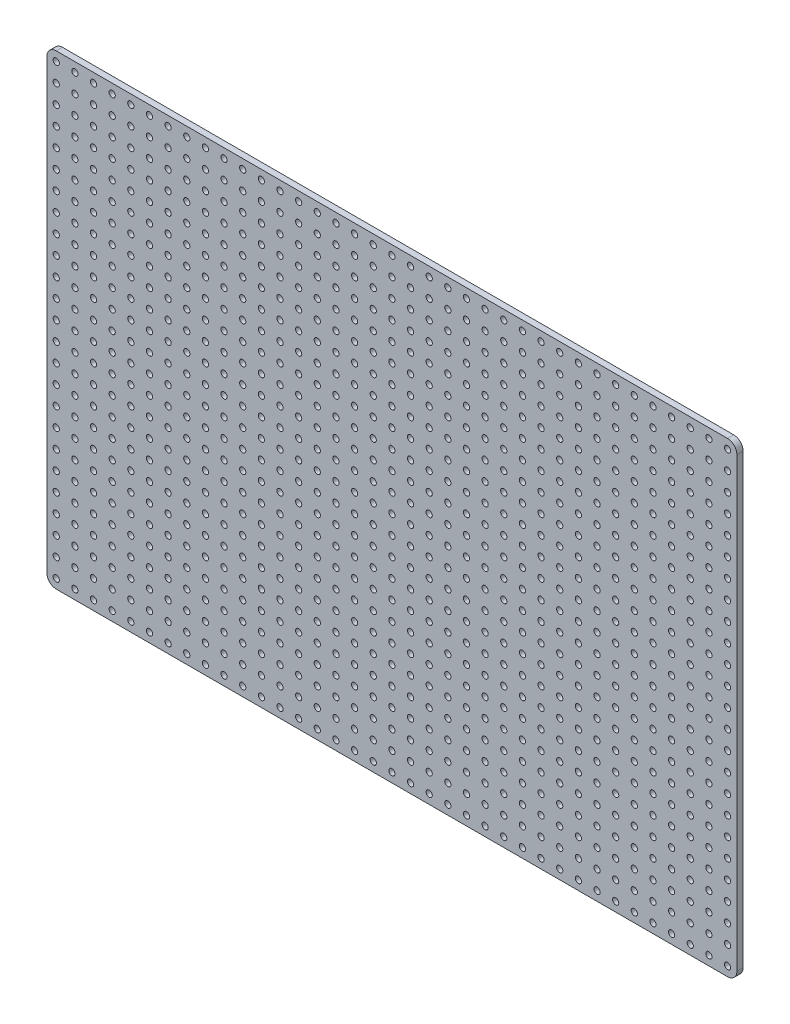
from build123d import *

# Parameters (mm, degrees)
MODEL_R                 = 1.5
SALIENTE_EXTRUIR1_DEPTH = 3


with BuildPart() as part:
    # Model → Saliente-Extruir1 (new body)
    with BuildSketch(Plane.XY):
        with BuildLine():
            Line((256.429131311, 471.742243614), (580.429131311, 471.742243614))
            ThreePointArc((580.429131311, 471.742243614), (583.611111826, 470.424224129), (584.929131311, 467.242243614))
            Line((584.929131311, 467.242243614), (584.929131311, 251.242243614))
            ThreePointArc((584.929131311, 251.242243614), (583.611111826, 248.060263099), (580.429131311, 246.742243614))
            Line((580.429131311, 246.742243614), (256.429131311, 246.742243614))
            ThreePointArc((256.429131311, 246.742243614), (253.247150795, 248.060263099), (251.929131311, 251.242243614))
            Line((251.929131311, 251.242243614), (251.929131311, 467.242243614))
            ThreePointArc((251.929131311, 467.242243614), (253.247150795, 470.424224129), (256.429131311, 471.742243614))
        make_face()
        with Locations((256.429131311, 467.242243614)):
            Circle(MODEL_R, mode=Mode.SUBTRACT)
        with Locations((256.429131311, 458.242243614)):
            Circle(MODEL_R, mode=Mode.SUBTRACT)
        with Locations((256.429131311, 449.242243614)):
            Circle(MODEL_R, mode=Mode.SUBTRACT)
        with Locations((256.429131311, 440.242243614)):
            Circle(MODEL_R, mode=Mode.SUBTRACT)
        with Locations((256.429131311, 431.242243614)):
            Circle(MODEL_R, mode=Mode.SUBTRACT)
        with Locations((256.429131311, 422.242243614)):
            Circle(MODEL_R, mode=Mode.SUBTRACT)
        with Locations((256.429131311, 413.242243614)):
            Circle(MODEL_R, mode=Mode.SUBTRACT)
        with Locations((256.429131311, 404.242243614)):
            Circle(MODEL_R, mode=Mode.SUBTRACT)
        with Locations((256.429131311, 395.242243614)):
            Circle(MODEL_R, mode=Mode.SUBTRACT)
        with Locations((256.429131311, 386.242243614)):
            Circle(MODEL_R, mode=Mode.SUBTRACT)
        with Locations((256.429131311, 377.242243614)):
            Circle(MODEL_R, mode=Mode.SUBTRACT)
        with Locations((256.429131311, 368.242243614)):
            Circle(MODEL_R, mode=Mode.SUBTRACT)
        with Locations((256.429131311, 359.242243614)):
            Circle(MODEL_R, mode=Mode.SUBTRACT)
        with Locations((256.429131311, 350.242243614)):
            Circle(MODEL_R, mode=Mode.SUBTRACT)
        with Locations((256.429131311, 341.242243614)):
            Circle(MODEL_R, mode=Mode.SUBTRACT)
        with Locations((256.429131311, 332.242243614)):
            Circle(MODEL_R, mode=Mode.SUBTRACT)
        with Locations((256.429131311, 323.242243614)):
            Circle(MODEL_R, mode=Mode.SUBTRACT)
        with Locations((256.429131311, 314.242243614)):
            Circle(MODEL_R, mode=Mode.SUBTRACT)
        with Locations((256.429131311, 305.242243614)):
            Circle(MODEL_R, mode=Mode.SUBTRACT)
        with Locations((265.429131311, 467.242243614)):
            Circle(MODEL_R, mode=Mode.SUBTRACT)
        with Locations((265.429131311, 458.242243614)):
            Circle(MODEL_R, mode=Mode.SUBTRACT)
        with Locations((265.429131311, 449.242243614)):
            Circle(MODEL_R, mode=Mode.SUBTRACT)
        with Locations((265.429131311, 440.242243614)):
            Circle(MODEL_R, mode=Mode.SUBTRACT)
        with Locations((265.429131311, 431.242243614)):
            Circle(MODEL_R, mode=Mode.SUBTRACT)
        with Locations((265.429131311, 422.242243614)):
            Circle(MODEL_R, mode=Mode.SUBTRACT)
        with Locations((265.429131311, 413.242243614)):
            Circle(MODEL_R, mode=Mode.SUBTRACT)
        with Locations((265.429131311, 404.242243614)):
            Circle(MODEL_R, mode=Mode.SUBTRACT)
        with Locations((265.429131311, 395.242243614)):
            Circle(MODEL_R, mode=Mode.SUBTRACT)
        with Locations((265.429131311, 386.242243614)):
            Circle(MODEL_R, mode=Mode.SUBTRACT)
        with Locations((265.429131311, 377.242243614)):
            Circle(MODEL_R, mode=Mode.SUBTRACT)
        with Locations((265.429131311, 368.242243614)):
            Circle(MODEL_R, mode=Mode.SUBTRACT)
        with Locations((265.429131311, 359.242243614)):
            Circle(MODEL_R, mode=Mode.SUBTRACT)
        with Locations((265.429131311, 350.242243614)):
            Circle(MODEL_R, mode=Mode.SUBTRACT)
        with Locations((265.429131311, 341.242243614)):
            Circle(MODEL_R, mode=Mode.SUBTRACT)
        with Locations((265.429131311, 332.242243614)):
            Circle(MODEL_R, mode=Mode.SUBTRACT)
        with Locations((265.429131311, 323.242243614)):
            Circle(MODEL_R, mode=Mode.SUBTRACT)
        with Locations((265.429131311, 314.242243614)):
            Circle(MODEL_R, mode=Mode.SUBTRACT)
        with Locations((265.429131311, 305.242243614)):
            Circle(MODEL_R, mode=Mode.SUBTRACT)
        with Locations((274.429131311, 467.242243614)):
            Circle(MODEL_R, mode=Mode.SUBTRACT)
        with Locations((274.429131311, 458.242243614)):
            Circle(MODEL_R, mode=Mode.SUBTRACT)
        with Locations((274.429131311, 449.242243614)):
            Circle(MODEL_R, mode=Mode.SUBTRACT)
        with Locations((274.429131311, 440.242243614)):
            Circle(MODEL_R, mode=Mode.SUBTRACT)
        with Locations((274.429131311, 431.242243614)):
            Circle(MODEL_R, mode=Mode.SUBTRACT)
        with Locations((274.429131311, 422.242243614)):
            Circle(MODEL_R, mode=Mode.SUBTRACT)
        with Locations((274.429131311, 413.242243614)):
            Circle(MODEL_R, mode=Mode.SUBTRACT)
        with Locations((274.429131311, 404.242243614)):
            Circle(MODEL_R, mode=Mode.SUBTRACT)
        with Locations((274.429131311, 395.242243614)):
            Circle(MODEL_R, mode=Mode.SUBTRACT)
        with Locations((274.429131311, 386.242243614)):
            Circle(MODEL_R, mode=Mode.SUBTRACT)
        with Locations((274.429131311, 377.242243614)):
            Circle(MODEL_R, mode=Mode.SUBTRACT)
        with Locations((274.429131311, 368.242243614)):
            Circle(MODEL_R, mode=Mode.SUBTRACT)
        with Locations((274.429131311, 359.242243614)):
            Circle(MODEL_R, mode=Mode.SUBTRACT)
        with Locations((274.429131311, 350.242243614)):
            Circle(MODEL_R, mode=Mode.SUBTRACT)
        with Locations((274.429131311, 341.242243614)):
            Circle(MODEL_R, mode=Mode.SUBTRACT)
        with Locations((274.429131311, 332.242243614)):
            Circle(MODEL_R, mode=Mode.SUBTRACT)
        with Locations((274.429131311, 323.242243614)):
            Circle(MODEL_R, mode=Mode.SUBTRACT)
        with Locations((274.429131311, 314.242243614)):
            Circle(MODEL_R, mode=Mode.SUBTRACT)
        with Locations((274.429131311, 305.242243614)):
            Circle(MODEL_R, mode=Mode.SUBTRACT)
        with Locations((283.429131311, 467.242243614)):
            Circle(MODEL_R, mode=Mode.SUBTRACT)
        with Locations((283.429131311, 458.242243614)):
            Circle(MODEL_R, mode=Mode.SUBTRACT)
        with Locations((283.429131311, 449.242243614)):
            Circle(MODEL_R, mode=Mode.SUBTRACT)
        with Locations((283.429131311, 440.242243614)):
            Circle(MODEL_R, mode=Mode.SUBTRACT)
        with Locations((283.429131311, 431.242243614)):
            Circle(MODEL_R, mode=Mode.SUBTRACT)
        with Locations((283.429131311, 422.242243614)):
            Circle(MODEL_R, mode=Mode.SUBTRACT)
        with Locations((283.429131311, 413.242243614)):
            Circle(MODEL_R, mode=Mode.SUBTRACT)
        with Locations((283.429131311, 404.242243614)):
            Circle(MODEL_R, mode=Mode.SUBTRACT)
        with Locations((283.429131311, 395.242243614)):
            Circle(MODEL_R, mode=Mode.SUBTRACT)
        with Locations((283.429131311, 386.242243614)):
            Circle(MODEL_R, mode=Mode.SUBTRACT)
        with Locations((283.429131311, 377.242243614)):
            Circle(MODEL_R, mode=Mode.SUBTRACT)
        with Locations((283.429131311, 368.242243614)):
            Circle(MODEL_R, mode=Mode.SUBTRACT)
        with Locations((283.429131311, 359.242243614)):
            Circle(MODEL_R, mode=Mode.SUBTRACT)
        with Locations((283.429131311, 350.242243614)):
            Circle(MODEL_R, mode=Mode.SUBTRACT)
        with Locations((283.429131311, 341.242243614)):
            Circle(MODEL_R, mode=Mode.SUBTRACT)
        with Locations((283.429131311, 332.242243614)):
            Circle(MODEL_R, mode=Mode.SUBTRACT)
        with Locations((283.429131311, 323.242243614)):
            Circle(MODEL_R, mode=Mode.SUBTRACT)
        with Locations((283.429131311, 314.242243614)):
            Circle(MODEL_R, mode=Mode.SUBTRACT)
        with Locations((283.429131311, 305.242243614)):
            Circle(MODEL_R, mode=Mode.SUBTRACT)
        with Locations((292.429131311, 467.242243614)):
            Circle(MODEL_R, mode=Mode.SUBTRACT)
        with Locations((292.429131311, 458.242243614)):
            Circle(MODEL_R, mode=Mode.SUBTRACT)
        with Locations((292.429131311, 449.242243614)):
            Circle(MODEL_R, mode=Mode.SUBTRACT)
        with Locations((292.429131311, 440.242243614)):
            Circle(MODEL_R, mode=Mode.SUBTRACT)
        with Locations((292.429131311, 431.242243614)):
            Circle(MODEL_R, mode=Mode.SUBTRACT)
        with Locations((292.429131311, 422.242243614)):
            Circle(MODEL_R, mode=Mode.SUBTRACT)
        with Locations((292.429131311, 413.242243614)):
            Circle(MODEL_R, mode=Mode.SUBTRACT)
        with Locations((292.429131311, 404.242243614)):
            Circle(MODEL_R, mode=Mode.SUBTRACT)
        with Locations((292.429131311, 395.242243614)):
            Circle(MODEL_R, mode=Mode.SUBTRACT)
        with Locations((292.429131311, 386.242243614)):
            Circle(MODEL_R, mode=Mode.SUBTRACT)
        with Locations((292.429131311, 377.242243614)):
            Circle(MODEL_R, mode=Mode.SUBTRACT)
        with Locations((292.429131311, 368.242243614)):
            Circle(MODEL_R, mode=Mode.SUBTRACT)
        with Locations((292.429131311, 359.242243614)):
            Circle(MODEL_R, mode=Mode.SUBTRACT)
        with Locations((292.429131311, 350.242243614)):
            Circle(MODEL_R, mode=Mode.SUBTRACT)
        with Locations((292.429131311, 341.242243614)):
            Circle(MODEL_R, mode=Mode.SUBTRACT)
        with Locations((292.429131311, 332.242243614)):
            Circle(MODEL_R, mode=Mode.SUBTRACT)
        with Locations((292.429131311, 323.242243614)):
            Circle(MODEL_R, mode=Mode.SUBTRACT)
        with Locations((292.429131311, 314.242243614)):
            Circle(MODEL_R, mode=Mode.SUBTRACT)
        with Locations((292.429131311, 305.242243614)):
            Circle(MODEL_R, mode=Mode.SUBTRACT)
        with Locations((301.429131311, 467.242243614)):
            Circle(MODEL_R, mode=Mode.SUBTRACT)
        with Locations((301.429131311, 458.242243614)):
            Circle(MODEL_R, mode=Mode.SUBTRACT)
        with Locations((301.429131311, 449.242243614)):
            Circle(MODEL_R, mode=Mode.SUBTRACT)
        with Locations((301.429131311, 440.242243614)):
            Circle(MODEL_R, mode=Mode.SUBTRACT)
        with Locations((301.429131311, 431.242243614)):
            Circle(MODEL_R, mode=Mode.SUBTRACT)
        with Locations((301.429131311, 422.242243614)):
            Circle(MODEL_R, mode=Mode.SUBTRACT)
        with Locations((301.429131311, 413.242243614)):
            Circle(MODEL_R, mode=Mode.SUBTRACT)
        with Locations((301.429131311, 404.242243614)):
            Circle(MODEL_R, mode=Mode.SUBTRACT)
        with Locations((301.429131311, 395.242243614)):
            Circle(MODEL_R, mode=Mode.SUBTRACT)
        with Locations((301.429131311, 386.242243614)):
            Circle(MODEL_R, mode=Mode.SUBTRACT)
        with Locations((301.429131311, 377.242243614)):
            Circle(MODEL_R, mode=Mode.SUBTRACT)
        with Locations((301.429131311, 368.242243614)):
            Circle(MODEL_R, mode=Mode.SUBTRACT)
        with Locations((301.429131311, 359.242243614)):
            Circle(MODEL_R, mode=Mode.SUBTRACT)
        with Locations((301.429131311, 350.242243614)):
            Circle(MODEL_R, mode=Mode.SUBTRACT)
        with Locations((301.429131311, 341.242243614)):
            Circle(MODEL_R, mode=Mode.SUBTRACT)
        with Locations((301.429131311, 332.242243614)):
            Circle(MODEL_R, mode=Mode.SUBTRACT)
        with Locations((301.429131311, 323.242243614)):
            Circle(MODEL_R, mode=Mode.SUBTRACT)
        with Locations((301.429131311, 314.242243614)):
            Circle(MODEL_R, mode=Mode.SUBTRACT)
        with Locations((301.429131311, 305.242243614)):
            Circle(MODEL_R, mode=Mode.SUBTRACT)
        with Locations((310.429131311, 467.242243614)):
            Circle(MODEL_R, mode=Mode.SUBTRACT)
        with Locations((310.429131311, 458.242243614)):
            Circle(MODEL_R, mode=Mode.SUBTRACT)
        with Locations((310.429131311, 449.242243614)):
            Circle(MODEL_R, mode=Mode.SUBTRACT)
        with Locations((310.429131311, 440.242243614)):
            Circle(MODEL_R, mode=Mode.SUBTRACT)
        with Locations((310.429131311, 431.242243614)):
            Circle(MODEL_R, mode=Mode.SUBTRACT)
        with Locations((310.429131311, 422.242243614)):
            Circle(MODEL_R, mode=Mode.SUBTRACT)
        with Locations((310.429131311, 413.242243614)):
            Circle(MODEL_R, mode=Mode.SUBTRACT)
        with Locations((310.429131311, 404.242243614)):
            Circle(MODEL_R, mode=Mode.SUBTRACT)
        with Locations((310.429131311, 395.242243614)):
            Circle(MODEL_R, mode=Mode.SUBTRACT)
        with Locations((310.429131311, 386.242243614)):
            Circle(MODEL_R, mode=Mode.SUBTRACT)
        with Locations((310.429131311, 377.242243614)):
            Circle(MODEL_R, mode=Mode.SUBTRACT)
        with Locations((310.429131311, 368.242243614)):
            Circle(MODEL_R, mode=Mode.SUBTRACT)
        with Locations((310.429131311, 359.242243614)):
            Circle(MODEL_R, mode=Mode.SUBTRACT)
        with Locations((310.429131311, 350.242243614)):
            Circle(MODEL_R, mode=Mode.SUBTRACT)
        with Locations((310.429131311, 341.242243614)):
            Circle(MODEL_R, mode=Mode.SUBTRACT)
        with Locations((310.429131311, 332.242243614)):
            Circle(MODEL_R, mode=Mode.SUBTRACT)
        with Locations((310.429131311, 323.242243614)):
            Circle(MODEL_R, mode=Mode.SUBTRACT)
        with Locations((310.429131311, 314.242243614)):
            Circle(MODEL_R, mode=Mode.SUBTRACT)
        with Locations((310.429131311, 305.242243614)):
            Circle(MODEL_R, mode=Mode.SUBTRACT)
        with Locations((319.429131311, 467.242243614)):
            Circle(MODEL_R, mode=Mode.SUBTRACT)
        with Locations((319.429131311, 458.242243614)):
            Circle(MODEL_R, mode=Mode.SUBTRACT)
        with Locations((319.429131311, 449.242243614)):
            Circle(MODEL_R, mode=Mode.SUBTRACT)
        with Locations((319.429131311, 440.242243614)):
            Circle(MODEL_R, mode=Mode.SUBTRACT)
        with Locations((319.429131311, 431.242243614)):
            Circle(MODEL_R, mode=Mode.SUBTRACT)
        with Locations((319.429131311, 422.242243614)):
            Circle(MODEL_R, mode=Mode.SUBTRACT)
        with Locations((319.429131311, 413.242243614)):
            Circle(MODEL_R, mode=Mode.SUBTRACT)
        with Locations((319.429131311, 404.242243614)):
            Circle(MODEL_R, mode=Mode.SUBTRACT)
        with Locations((319.429131311, 395.242243614)):
            Circle(MODEL_R, mode=Mode.SUBTRACT)
        with Locations((319.429131311, 386.242243614)):
            Circle(MODEL_R, mode=Mode.SUBTRACT)
        with Locations((319.429131311, 377.242243614)):
            Circle(MODEL_R, mode=Mode.SUBTRACT)
        with Locations((319.429131311, 368.242243614)):
            Circle(MODEL_R, mode=Mode.SUBTRACT)
        with Locations((319.429131311, 359.242243614)):
            Circle(MODEL_R, mode=Mode.SUBTRACT)
        with Locations((319.429131311, 350.242243614)):
            Circle(MODEL_R, mode=Mode.SUBTRACT)
        with Locations((319.429131311, 341.242243614)):
            Circle(MODEL_R, mode=Mode.SUBTRACT)
        with Locations((319.429131311, 332.242243614)):
            Circle(MODEL_R, mode=Mode.SUBTRACT)
        with Locations((319.429131311, 323.242243614)):
            Circle(MODEL_R, mode=Mode.SUBTRACT)
        with Locations((319.429131311, 314.242243614)):
            Circle(MODEL_R, mode=Mode.SUBTRACT)
        with Locations((319.429131311, 305.242243614)):
            Circle(MODEL_R, mode=Mode.SUBTRACT)
        with Locations((328.429131311, 467.242243614)):
            Circle(MODEL_R, mode=Mode.SUBTRACT)
        with Locations((328.429131311, 458.242243614)):
            Circle(MODEL_R, mode=Mode.SUBTRACT)
        with Locations((328.429131311, 449.242243614)):
            Circle(MODEL_R, mode=Mode.SUBTRACT)
        with Locations((328.429131311, 440.242243614)):
            Circle(MODEL_R, mode=Mode.SUBTRACT)
        with Locations((328.429131311, 431.242243614)):
            Circle(MODEL_R, mode=Mode.SUBTRACT)
        with Locations((328.429131311, 422.242243614)):
            Circle(MODEL_R, mode=Mode.SUBTRACT)
        with Locations((328.429131311, 413.242243614)):
            Circle(MODEL_R, mode=Mode.SUBTRACT)
        with Locations((328.429131311, 404.242243614)):
            Circle(MODEL_R, mode=Mode.SUBTRACT)
        with Locations((328.429131311, 395.242243614)):
            Circle(MODEL_R, mode=Mode.SUBTRACT)
        with Locations((328.429131311, 386.242243614)):
            Circle(MODEL_R, mode=Mode.SUBTRACT)
        with Locations((328.429131311, 377.242243614)):
            Circle(MODEL_R, mode=Mode.SUBTRACT)
        with Locations((328.429131311, 368.242243614)):
            Circle(MODEL_R, mode=Mode.SUBTRACT)
        with Locations((328.429131311, 359.242243614)):
            Circle(MODEL_R, mode=Mode.SUBTRACT)
        with Locations((328.429131311, 350.242243614)):
            Circle(MODEL_R, mode=Mode.SUBTRACT)
        with Locations((328.429131311, 341.242243614)):
            Circle(MODEL_R, mode=Mode.SUBTRACT)
        with Locations((328.429131311, 332.242243614)):
            Circle(MODEL_R, mode=Mode.SUBTRACT)
        with Locations((328.429131311, 323.242243614)):
            Circle(MODEL_R, mode=Mode.SUBTRACT)
        with Locations((328.429131311, 314.242243614)):
            Circle(MODEL_R, mode=Mode.SUBTRACT)
        with Locations((328.429131311, 305.242243614)):
            Circle(MODEL_R, mode=Mode.SUBTRACT)
        with Locations((337.429131311, 467.242243614)):
            Circle(MODEL_R, mode=Mode.SUBTRACT)
        with Locations((337.429131311, 458.242243614)):
            Circle(MODEL_R, mode=Mode.SUBTRACT)
        with Locations((337.429131311, 449.242243614)):
            Circle(MODEL_R, mode=Mode.SUBTRACT)
        with Locations((337.429131311, 440.242243614)):
            Circle(MODEL_R, mode=Mode.SUBTRACT)
        with Locations((337.429131311, 431.242243614)):
            Circle(MODEL_R, mode=Mode.SUBTRACT)
        with Locations((337.429131311, 422.242243614)):
            Circle(MODEL_R, mode=Mode.SUBTRACT)
        with Locations((337.429131311, 413.242243614)):
            Circle(MODEL_R, mode=Mode.SUBTRACT)
        with Locations((337.429131311, 404.242243614)):
            Circle(MODEL_R, mode=Mode.SUBTRACT)
        with Locations((337.429131311, 395.242243614)):
            Circle(MODEL_R, mode=Mode.SUBTRACT)
        with Locations((337.429131311, 386.242243614)):
            Circle(MODEL_R, mode=Mode.SUBTRACT)
        with Locations((337.429131311, 377.242243614)):
            Circle(MODEL_R, mode=Mode.SUBTRACT)
        with Locations((337.429131311, 368.242243614)):
            Circle(MODEL_R, mode=Mode.SUBTRACT)
        with Locations((337.429131311, 359.242243614)):
            Circle(MODEL_R, mode=Mode.SUBTRACT)
        with Locations((337.429131311, 350.242243614)):
            Circle(MODEL_R, mode=Mode.SUBTRACT)
        with Locations((337.429131311, 341.242243614)):
            Circle(MODEL_R, mode=Mode.SUBTRACT)
        with Locations((337.429131311, 332.242243614)):
            Circle(MODEL_R, mode=Mode.SUBTRACT)
        with Locations((337.429131311, 323.242243614)):
            Circle(MODEL_R, mode=Mode.SUBTRACT)
        with Locations((337.429131311, 314.242243614)):
            Circle(MODEL_R, mode=Mode.SUBTRACT)
        with Locations((337.429131311, 305.242243614)):
            Circle(MODEL_R, mode=Mode.SUBTRACT)
        with Locations((346.429131311, 467.242243614)):
            Circle(MODEL_R, mode=Mode.SUBTRACT)
        with Locations((346.429131311, 458.242243614)):
            Circle(MODEL_R, mode=Mode.SUBTRACT)
        with Locations((346.429131311, 449.242243614)):
            Circle(MODEL_R, mode=Mode.SUBTRACT)
        with Locations((346.429131311, 440.242243614)):
            Circle(MODEL_R, mode=Mode.SUBTRACT)
        with Locations((346.429131311, 431.242243614)):
            Circle(MODEL_R, mode=Mode.SUBTRACT)
        with Locations((346.429131311, 422.242243614)):
            Circle(MODEL_R, mode=Mode.SUBTRACT)
        with Locations((346.429131311, 413.242243614)):
            Circle(MODEL_R, mode=Mode.SUBTRACT)
        with Locations((346.429131311, 404.242243614)):
            Circle(MODEL_R, mode=Mode.SUBTRACT)
        with Locations((346.429131311, 395.242243614)):
            Circle(MODEL_R, mode=Mode.SUBTRACT)
        with Locations((346.429131311, 386.242243614)):
            Circle(MODEL_R, mode=Mode.SUBTRACT)
        with Locations((346.429131311, 377.242243614)):
            Circle(MODEL_R, mode=Mode.SUBTRACT)
        with Locations((346.429131311, 368.242243614)):
            Circle(MODEL_R, mode=Mode.SUBTRACT)
        with Locations((346.429131311, 359.242243614)):
            Circle(MODEL_R, mode=Mode.SUBTRACT)
        with Locations((346.429131311, 350.242243614)):
            Circle(MODEL_R, mode=Mode.SUBTRACT)
        with Locations((346.429131311, 341.242243614)):
            Circle(MODEL_R, mode=Mode.SUBTRACT)
        with Locations((346.429131311, 332.242243614)):
            Circle(MODEL_R, mode=Mode.SUBTRACT)
        with Locations((346.429131311, 323.242243614)):
            Circle(MODEL_R, mode=Mode.SUBTRACT)
        with Locations((346.429131311, 314.242243614)):
            Circle(MODEL_R, mode=Mode.SUBTRACT)
        with Locations((346.429131311, 305.242243614)):
            Circle(MODEL_R, mode=Mode.SUBTRACT)
        with Locations((355.429131311, 467.242243614)):
            Circle(MODEL_R, mode=Mode.SUBTRACT)
        with Locations((355.429131311, 458.242243614)):
            Circle(MODEL_R, mode=Mode.SUBTRACT)
        with Locations((355.429131311, 449.242243614)):
            Circle(MODEL_R, mode=Mode.SUBTRACT)
        with Locations((355.429131311, 440.242243614)):
            Circle(MODEL_R, mode=Mode.SUBTRACT)
        with Locations((355.429131311, 431.242243614)):
            Circle(MODEL_R, mode=Mode.SUBTRACT)
        with Locations((355.429131311, 422.242243614)):
            Circle(MODEL_R, mode=Mode.SUBTRACT)
        with Locations((355.429131311, 413.242243614)):
            Circle(MODEL_R, mode=Mode.SUBTRACT)
        with Locations((355.429131311, 404.242243614)):
            Circle(MODEL_R, mode=Mode.SUBTRACT)
        with Locations((355.429131311, 395.242243614)):
            Circle(MODEL_R, mode=Mode.SUBTRACT)
        with Locations((355.429131311, 386.242243614)):
            Circle(MODEL_R, mode=Mode.SUBTRACT)
        with Locations((355.429131311, 377.242243614)):
            Circle(MODEL_R, mode=Mode.SUBTRACT)
        with Locations((355.429131311, 368.242243614)):
            Circle(MODEL_R, mode=Mode.SUBTRACT)
        with Locations((355.429131311, 359.242243614)):
            Circle(MODEL_R, mode=Mode.SUBTRACT)
        with Locations((355.429131311, 350.242243614)):
            Circle(MODEL_R, mode=Mode.SUBTRACT)
        with Locations((355.429131311, 341.242243614)):
            Circle(MODEL_R, mode=Mode.SUBTRACT)
        with Locations((355.429131311, 332.242243614)):
            Circle(MODEL_R, mode=Mode.SUBTRACT)
        with Locations((355.429131311, 323.242243614)):
            Circle(MODEL_R, mode=Mode.SUBTRACT)
        with Locations((355.429131311, 314.242243614)):
            Circle(MODEL_R, mode=Mode.SUBTRACT)
        with Locations((355.429131311, 305.242243614)):
            Circle(MODEL_R, mode=Mode.SUBTRACT)
        with Locations((364.429131311, 467.242243614)):
            Circle(MODEL_R, mode=Mode.SUBTRACT)
        with Locations((364.429131311, 458.242243614)):
            Circle(MODEL_R, mode=Mode.SUBTRACT)
        with Locations((364.429131311, 449.242243614)):
            Circle(MODEL_R, mode=Mode.SUBTRACT)
        with Locations((364.429131311, 440.242243614)):
            Circle(MODEL_R, mode=Mode.SUBTRACT)
        with Locations((364.429131311, 431.242243614)):
            Circle(MODEL_R, mode=Mode.SUBTRACT)
        with Locations((364.429131311, 422.242243614)):
            Circle(MODEL_R, mode=Mode.SUBTRACT)
        with Locations((364.429131311, 413.242243614)):
            Circle(MODEL_R, mode=Mode.SUBTRACT)
        with Locations((364.429131311, 404.242243614)):
            Circle(MODEL_R, mode=Mode.SUBTRACT)
        with Locations((364.429131311, 395.242243614)):
            Circle(MODEL_R, mode=Mode.SUBTRACT)
        with Locations((364.429131311, 386.242243614)):
            Circle(MODEL_R, mode=Mode.SUBTRACT)
        with Locations((364.429131311, 377.242243614)):
            Circle(MODEL_R, mode=Mode.SUBTRACT)
        with Locations((364.429131311, 368.242243614)):
            Circle(MODEL_R, mode=Mode.SUBTRACT)
        with Locations((364.429131311, 359.242243614)):
            Circle(MODEL_R, mode=Mode.SUBTRACT)
        with Locations((364.429131311, 350.242243614)):
            Circle(MODEL_R, mode=Mode.SUBTRACT)
        with Locations((364.429131311, 341.242243614)):
            Circle(MODEL_R, mode=Mode.SUBTRACT)
        with Locations((364.429131311, 332.242243614)):
            Circle(MODEL_R, mode=Mode.SUBTRACT)
        with Locations((364.429131311, 323.242243614)):
            Circle(MODEL_R, mode=Mode.SUBTRACT)
        with Locations((364.429131311, 314.242243614)):
            Circle(MODEL_R, mode=Mode.SUBTRACT)
        with Locations((364.429131311, 305.242243614)):
            Circle(MODEL_R, mode=Mode.SUBTRACT)
        with Locations((373.429131311, 467.242243614)):
            Circle(MODEL_R, mode=Mode.SUBTRACT)
        with Locations((373.429131311, 458.242243614)):
            Circle(MODEL_R, mode=Mode.SUBTRACT)
        with Locations((373.429131311, 449.242243614)):
            Circle(MODEL_R, mode=Mode.SUBTRACT)
        with Locations((373.429131311, 440.242243614)):
            Circle(MODEL_R, mode=Mode.SUBTRACT)
        with Locations((373.429131311, 431.242243614)):
            Circle(MODEL_R, mode=Mode.SUBTRACT)
        with Locations((373.429131311, 422.242243614)):
            Circle(MODEL_R, mode=Mode.SUBTRACT)
        with Locations((373.429131311, 413.242243614)):
            Circle(MODEL_R, mode=Mode.SUBTRACT)
        with Locations((373.429131311, 404.242243614)):
            Circle(MODEL_R, mode=Mode.SUBTRACT)
        with Locations((373.429131311, 395.242243614)):
            Circle(MODEL_R, mode=Mode.SUBTRACT)
        with Locations((373.429131311, 386.242243614)):
            Circle(MODEL_R, mode=Mode.SUBTRACT)
        with Locations((373.429131311, 377.242243614)):
            Circle(MODEL_R, mode=Mode.SUBTRACT)
        with Locations((373.429131311, 368.242243614)):
            Circle(MODEL_R, mode=Mode.SUBTRACT)
        with Locations((373.429131311, 359.242243614)):
            Circle(MODEL_R, mode=Mode.SUBTRACT)
        with Locations((373.429131311, 350.242243614)):
            Circle(MODEL_R, mode=Mode.SUBTRACT)
        with Locations((373.429131311, 341.242243614)):
            Circle(MODEL_R, mode=Mode.SUBTRACT)
        with Locations((373.429131311, 332.242243614)):
            Circle(MODEL_R, mode=Mode.SUBTRACT)
        with Locations((373.429131311, 323.242243614)):
            Circle(MODEL_R, mode=Mode.SUBTRACT)
        with Locations((373.429131311, 314.242243614)):
            Circle(MODEL_R, mode=Mode.SUBTRACT)
        with Locations((373.429131311, 305.242243614)):
            Circle(MODEL_R, mode=Mode.SUBTRACT)
        with Locations((382.429131311, 467.242243614)):
            Circle(MODEL_R, mode=Mode.SUBTRACT)
        with Locations((382.429131311, 458.242243614)):
            Circle(MODEL_R, mode=Mode.SUBTRACT)
        with Locations((382.429131311, 449.242243614)):
            Circle(MODEL_R, mode=Mode.SUBTRACT)
        with Locations((382.429131311, 440.242243614)):
            Circle(MODEL_R, mode=Mode.SUBTRACT)
        with Locations((382.429131311, 431.242243614)):
            Circle(MODEL_R, mode=Mode.SUBTRACT)
        with Locations((382.429131311, 422.242243614)):
            Circle(MODEL_R, mode=Mode.SUBTRACT)
        with Locations((382.429131311, 413.242243614)):
            Circle(MODEL_R, mode=Mode.SUBTRACT)
        with Locations((382.429131311, 404.242243614)):
            Circle(MODEL_R, mode=Mode.SUBTRACT)
        with Locations((382.429131311, 395.242243614)):
            Circle(MODEL_R, mode=Mode.SUBTRACT)
        with Locations((382.429131311, 386.242243614)):
            Circle(MODEL_R, mode=Mode.SUBTRACT)
        with Locations((382.429131311, 377.242243614)):
            Circle(MODEL_R, mode=Mode.SUBTRACT)
        with Locations((382.429131311, 368.242243614)):
            Circle(MODEL_R, mode=Mode.SUBTRACT)
        with Locations((382.429131311, 359.242243614)):
            Circle(MODEL_R, mode=Mode.SUBTRACT)
        with Locations((382.429131311, 350.242243614)):
            Circle(MODEL_R, mode=Mode.SUBTRACT)
        with Locations((382.429131311, 341.242243614)):
            Circle(MODEL_R, mode=Mode.SUBTRACT)
        with Locations((382.429131311, 332.242243614)):
            Circle(MODEL_R, mode=Mode.SUBTRACT)
        with Locations((382.429131311, 323.242243614)):
            Circle(MODEL_R, mode=Mode.SUBTRACT)
        with Locations((382.429131311, 314.242243614)):
            Circle(MODEL_R, mode=Mode.SUBTRACT)
        with Locations((382.429131311, 305.242243614)):
            Circle(MODEL_R, mode=Mode.SUBTRACT)
        with Locations((391.429131311, 467.242243614)):
            Circle(MODEL_R, mode=Mode.SUBTRACT)
        with Locations((391.429131311, 458.242243614)):
            Circle(MODEL_R, mode=Mode.SUBTRACT)
        with Locations((391.429131311, 449.242243614)):
            Circle(MODEL_R, mode=Mode.SUBTRACT)
        with Locations((391.429131311, 440.242243614)):
            Circle(MODEL_R, mode=Mode.SUBTRACT)
        with Locations((391.429131311, 431.242243614)):
            Circle(MODEL_R, mode=Mode.SUBTRACT)
        with Locations((391.429131311, 422.242243614)):
            Circle(MODEL_R, mode=Mode.SUBTRACT)
        with Locations((391.429131311, 413.242243614)):
            Circle(MODEL_R, mode=Mode.SUBTRACT)
        with Locations((391.429131311, 404.242243614)):
            Circle(MODEL_R, mode=Mode.SUBTRACT)
        with Locations((391.429131311, 395.242243614)):
            Circle(MODEL_R, mode=Mode.SUBTRACT)
        with Locations((391.429131311, 386.242243614)):
            Circle(MODEL_R, mode=Mode.SUBTRACT)
        with Locations((391.429131311, 377.242243614)):
            Circle(MODEL_R, mode=Mode.SUBTRACT)
        with Locations((391.429131311, 368.242243614)):
            Circle(MODEL_R, mode=Mode.SUBTRACT)
        with Locations((391.429131311, 359.242243614)):
            Circle(MODEL_R, mode=Mode.SUBTRACT)
        with Locations((391.429131311, 350.242243614)):
            Circle(MODEL_R, mode=Mode.SUBTRACT)
        with Locations((391.429131311, 341.242243614)):
            Circle(MODEL_R, mode=Mode.SUBTRACT)
        with Locations((391.429131311, 332.242243614)):
            Circle(MODEL_R, mode=Mode.SUBTRACT)
        with Locations((391.429131311, 323.242243614)):
            Circle(MODEL_R, mode=Mode.SUBTRACT)
        with Locations((391.429131311, 314.242243614)):
            Circle(MODEL_R, mode=Mode.SUBTRACT)
        with Locations((391.429131311, 305.242243614)):
            Circle(MODEL_R, mode=Mode.SUBTRACT)
        with Locations((400.429131311, 467.242243614)):
            Circle(MODEL_R, mode=Mode.SUBTRACT)
        with Locations((400.429131311, 458.242243614)):
            Circle(MODEL_R, mode=Mode.SUBTRACT)
        with Locations((400.429131311, 449.242243614)):
            Circle(MODEL_R, mode=Mode.SUBTRACT)
        with Locations((400.429131311, 440.242243614)):
            Circle(MODEL_R, mode=Mode.SUBTRACT)
        with Locations((400.429131311, 431.242243614)):
            Circle(MODEL_R, mode=Mode.SUBTRACT)
        with Locations((400.429131311, 422.242243614)):
            Circle(MODEL_R, mode=Mode.SUBTRACT)
        with Locations((400.429131311, 413.242243614)):
            Circle(MODEL_R, mode=Mode.SUBTRACT)
        with Locations((400.429131311, 404.242243614)):
            Circle(MODEL_R, mode=Mode.SUBTRACT)
        with Locations((400.429131311, 395.242243614)):
            Circle(MODEL_R, mode=Mode.SUBTRACT)
        with Locations((400.429131311, 386.242243614)):
            Circle(MODEL_R, mode=Mode.SUBTRACT)
        with Locations((400.429131311, 377.242243614)):
            Circle(MODEL_R, mode=Mode.SUBTRACT)
        with Locations((400.429131311, 368.242243614)):
            Circle(MODEL_R, mode=Mode.SUBTRACT)
        with Locations((400.429131311, 359.242243614)):
            Circle(MODEL_R, mode=Mode.SUBTRACT)
        with Locations((400.429131311, 350.242243614)):
            Circle(MODEL_R, mode=Mode.SUBTRACT)
        with Locations((400.429131311, 341.242243614)):
            Circle(MODEL_R, mode=Mode.SUBTRACT)
        with Locations((400.429131311, 332.242243614)):
            Circle(MODEL_R, mode=Mode.SUBTRACT)
        with Locations((400.429131311, 323.242243614)):
            Circle(MODEL_R, mode=Mode.SUBTRACT)
        with Locations((400.429131311, 314.242243614)):
            Circle(MODEL_R, mode=Mode.SUBTRACT)
        with Locations((400.429131311, 305.242243614)):
            Circle(MODEL_R, mode=Mode.SUBTRACT)
        with Locations((409.429131311, 467.242243614)):
            Circle(MODEL_R, mode=Mode.SUBTRACT)
        with Locations((409.429131311, 458.242243614)):
            Circle(MODEL_R, mode=Mode.SUBTRACT)
        with Locations((409.429131311, 449.242243614)):
            Circle(MODEL_R, mode=Mode.SUBTRACT)
        with Locations((409.429131311, 440.242243614)):
            Circle(MODEL_R, mode=Mode.SUBTRACT)
        with Locations((409.429131311, 431.242243614)):
            Circle(MODEL_R, mode=Mode.SUBTRACT)
        with Locations((409.429131311, 422.242243614)):
            Circle(MODEL_R, mode=Mode.SUBTRACT)
        with Locations((409.429131311, 413.242243614)):
            Circle(MODEL_R, mode=Mode.SUBTRACT)
        with Locations((409.429131311, 404.242243614)):
            Circle(MODEL_R, mode=Mode.SUBTRACT)
        with Locations((409.429131311, 395.242243614)):
            Circle(MODEL_R, mode=Mode.SUBTRACT)
        with Locations((409.429131311, 386.242243614)):
            Circle(MODEL_R, mode=Mode.SUBTRACT)
        with Locations((409.429131311, 377.242243614)):
            Circle(MODEL_R, mode=Mode.SUBTRACT)
        with Locations((409.429131311, 368.242243614)):
            Circle(MODEL_R, mode=Mode.SUBTRACT)
        with Locations((409.429131311, 359.242243614)):
            Circle(MODEL_R, mode=Mode.SUBTRACT)
        with Locations((409.429131311, 350.242243614)):
            Circle(MODEL_R, mode=Mode.SUBTRACT)
        with Locations((409.429131311, 341.242243614)):
            Circle(MODEL_R, mode=Mode.SUBTRACT)
        with Locations((409.429131311, 332.242243614)):
            Circle(MODEL_R, mode=Mode.SUBTRACT)
        with Locations((409.429131311, 323.242243614)):
            Circle(MODEL_R, mode=Mode.SUBTRACT)
        with Locations((409.429131311, 314.242243614)):
            Circle(MODEL_R, mode=Mode.SUBTRACT)
        with Locations((409.429131311, 305.242243614)):
            Circle(MODEL_R, mode=Mode.SUBTRACT)
        with Locations((418.429131311, 467.242243614)):
            Circle(MODEL_R, mode=Mode.SUBTRACT)
        with Locations((418.429131311, 458.242243614)):
            Circle(MODEL_R, mode=Mode.SUBTRACT)
        with Locations((418.429131311, 449.242243614)):
            Circle(MODEL_R, mode=Mode.SUBTRACT)
        with Locations((418.429131311, 440.242243614)):
            Circle(MODEL_R, mode=Mode.SUBTRACT)
        with Locations((418.429131311, 431.242243614)):
            Circle(MODEL_R, mode=Mode.SUBTRACT)
        with Locations((418.429131311, 422.242243614)):
            Circle(MODEL_R, mode=Mode.SUBTRACT)
        with Locations((418.429131311, 413.242243614)):
            Circle(MODEL_R, mode=Mode.SUBTRACT)
        with Locations((418.429131311, 404.242243614)):
            Circle(MODEL_R, mode=Mode.SUBTRACT)
        with Locations((418.429131311, 395.242243614)):
            Circle(MODEL_R, mode=Mode.SUBTRACT)
        with Locations((418.429131311, 386.242243614)):
            Circle(MODEL_R, mode=Mode.SUBTRACT)
        with Locations((418.429131311, 377.242243614)):
            Circle(MODEL_R, mode=Mode.SUBTRACT)
        with Locations((418.429131311, 368.242243614)):
            Circle(MODEL_R, mode=Mode.SUBTRACT)
        with Locations((418.429131311, 359.242243614)):
            Circle(MODEL_R, mode=Mode.SUBTRACT)
        with Locations((418.429131311, 350.242243614)):
            Circle(MODEL_R, mode=Mode.SUBTRACT)
        with Locations((418.429131311, 341.242243614)):
            Circle(MODEL_R, mode=Mode.SUBTRACT)
        with Locations((418.429131311, 332.242243614)):
            Circle(MODEL_R, mode=Mode.SUBTRACT)
        with Locations((418.429131311, 323.242243614)):
            Circle(MODEL_R, mode=Mode.SUBTRACT)
        with Locations((418.429131311, 314.242243614)):
            Circle(MODEL_R, mode=Mode.SUBTRACT)
        with Locations((418.429131311, 305.242243614)):
            Circle(MODEL_R, mode=Mode.SUBTRACT)
        with Locations((427.429131311, 467.242243614)):
            Circle(MODEL_R, mode=Mode.SUBTRACT)
        with Locations((427.429131311, 458.242243614)):
            Circle(MODEL_R, mode=Mode.SUBTRACT)
        with Locations((427.429131311, 449.242243614)):
            Circle(MODEL_R, mode=Mode.SUBTRACT)
        with Locations((427.429131311, 440.242243614)):
            Circle(MODEL_R, mode=Mode.SUBTRACT)
        with Locations((427.429131311, 431.242243614)):
            Circle(MODEL_R, mode=Mode.SUBTRACT)
        with Locations((427.429131311, 422.242243614)):
            Circle(MODEL_R, mode=Mode.SUBTRACT)
        with Locations((427.429131311, 413.242243614)):
            Circle(MODEL_R, mode=Mode.SUBTRACT)
        with Locations((427.429131311, 404.242243614)):
            Circle(MODEL_R, mode=Mode.SUBTRACT)
        with Locations((427.429131311, 395.242243614)):
            Circle(MODEL_R, mode=Mode.SUBTRACT)
        with Locations((427.429131311, 386.242243614)):
            Circle(MODEL_R, mode=Mode.SUBTRACT)
        with Locations((427.429131311, 377.242243614)):
            Circle(MODEL_R, mode=Mode.SUBTRACT)
        with Locations((427.429131311, 368.242243614)):
            Circle(MODEL_R, mode=Mode.SUBTRACT)
        with Locations((427.429131311, 359.242243614)):
            Circle(MODEL_R, mode=Mode.SUBTRACT)
        with Locations((427.429131311, 350.242243614)):
            Circle(MODEL_R, mode=Mode.SUBTRACT)
        with Locations((427.429131311, 341.242243614)):
            Circle(MODEL_R, mode=Mode.SUBTRACT)
        with Locations((427.429131311, 332.242243614)):
            Circle(MODEL_R, mode=Mode.SUBTRACT)
        with Locations((427.429131311, 323.242243614)):
            Circle(MODEL_R, mode=Mode.SUBTRACT)
        with Locations((427.429131311, 314.242243614)):
            Circle(MODEL_R, mode=Mode.SUBTRACT)
        with Locations((427.429131311, 305.242243614)):
            Circle(MODEL_R, mode=Mode.SUBTRACT)
        with Locations((436.429131311, 467.242243614)):
            Circle(MODEL_R, mode=Mode.SUBTRACT)
        with Locations((436.429131311, 458.242243614)):
            Circle(MODEL_R, mode=Mode.SUBTRACT)
        with Locations((436.429131311, 449.242243614)):
            Circle(MODEL_R, mode=Mode.SUBTRACT)
        with Locations((436.429131311, 440.242243614)):
            Circle(MODEL_R, mode=Mode.SUBTRACT)
        with Locations((436.429131311, 431.242243614)):
            Circle(MODEL_R, mode=Mode.SUBTRACT)
        with Locations((436.429131311, 422.242243614)):
            Circle(MODEL_R, mode=Mode.SUBTRACT)
        with Locations((436.429131311, 413.242243614)):
            Circle(MODEL_R, mode=Mode.SUBTRACT)
        with Locations((436.429131311, 404.242243614)):
            Circle(MODEL_R, mode=Mode.SUBTRACT)
        with Locations((436.429131311, 395.242243614)):
            Circle(MODEL_R, mode=Mode.SUBTRACT)
        with Locations((436.429131311, 386.242243614)):
            Circle(MODEL_R, mode=Mode.SUBTRACT)
        with Locations((436.429131311, 377.242243614)):
            Circle(MODEL_R, mode=Mode.SUBTRACT)
        with Locations((436.429131311, 368.242243614)):
            Circle(MODEL_R, mode=Mode.SUBTRACT)
        with Locations((436.429131311, 359.242243614)):
            Circle(MODEL_R, mode=Mode.SUBTRACT)
        with Locations((436.429131311, 350.242243614)):
            Circle(MODEL_R, mode=Mode.SUBTRACT)
        with Locations((436.429131311, 341.242243614)):
            Circle(MODEL_R, mode=Mode.SUBTRACT)
        with Locations((436.429131311, 332.242243614)):
            Circle(MODEL_R, mode=Mode.SUBTRACT)
        with Locations((436.429131311, 323.242243614)):
            Circle(MODEL_R, mode=Mode.SUBTRACT)
        with Locations((436.429131311, 314.242243614)):
            Circle(MODEL_R, mode=Mode.SUBTRACT)
        with Locations((436.429131311, 305.242243614)):
            Circle(MODEL_R, mode=Mode.SUBTRACT)
        with Locations((445.429131311, 467.242243614)):
            Circle(MODEL_R, mode=Mode.SUBTRACT)
        with Locations((445.429131311, 458.242243614)):
            Circle(MODEL_R, mode=Mode.SUBTRACT)
        with Locations((445.429131311, 449.242243614)):
            Circle(MODEL_R, mode=Mode.SUBTRACT)
        with Locations((445.429131311, 440.242243614)):
            Circle(MODEL_R, mode=Mode.SUBTRACT)
        with Locations((445.429131311, 431.242243614)):
            Circle(MODEL_R, mode=Mode.SUBTRACT)
        with Locations((445.429131311, 422.242243614)):
            Circle(MODEL_R, mode=Mode.SUBTRACT)
        with Locations((445.429131311, 413.242243614)):
            Circle(MODEL_R, mode=Mode.SUBTRACT)
        with Locations((445.429131311, 404.242243614)):
            Circle(MODEL_R, mode=Mode.SUBTRACT)
        with Locations((445.429131311, 395.242243614)):
            Circle(MODEL_R, mode=Mode.SUBTRACT)
        with Locations((445.429131311, 386.242243614)):
            Circle(MODEL_R, mode=Mode.SUBTRACT)
        with Locations((445.429131311, 377.242243614)):
            Circle(MODEL_R, mode=Mode.SUBTRACT)
        with Locations((445.429131311, 368.242243614)):
            Circle(MODEL_R, mode=Mode.SUBTRACT)
        with Locations((445.429131311, 359.242243614)):
            Circle(MODEL_R, mode=Mode.SUBTRACT)
        with Locations((445.429131311, 350.242243614)):
            Circle(MODEL_R, mode=Mode.SUBTRACT)
        with Locations((445.429131311, 341.242243614)):
            Circle(MODEL_R, mode=Mode.SUBTRACT)
        with Locations((445.429131311, 332.242243614)):
            Circle(MODEL_R, mode=Mode.SUBTRACT)
        with Locations((445.429131311, 323.242243614)):
            Circle(MODEL_R, mode=Mode.SUBTRACT)
        with Locations((445.429131311, 314.242243614)):
            Circle(MODEL_R, mode=Mode.SUBTRACT)
        with Locations((445.429131311, 305.242243614)):
            Circle(MODEL_R, mode=Mode.SUBTRACT)
        with Locations((454.429131311, 467.242243614)):
            Circle(MODEL_R, mode=Mode.SUBTRACT)
        with Locations((454.429131311, 458.242243614)):
            Circle(MODEL_R, mode=Mode.SUBTRACT)
        with Locations((454.429131311, 449.242243614)):
            Circle(MODEL_R, mode=Mode.SUBTRACT)
        with Locations((454.429131311, 440.242243614)):
            Circle(MODEL_R, mode=Mode.SUBTRACT)
        with Locations((454.429131311, 431.242243614)):
            Circle(MODEL_R, mode=Mode.SUBTRACT)
        with Locations((454.429131311, 422.242243614)):
            Circle(MODEL_R, mode=Mode.SUBTRACT)
        with Locations((454.429131311, 413.242243614)):
            Circle(MODEL_R, mode=Mode.SUBTRACT)
        with Locations((454.429131311, 404.242243614)):
            Circle(MODEL_R, mode=Mode.SUBTRACT)
        with Locations((454.429131311, 395.242243614)):
            Circle(MODEL_R, mode=Mode.SUBTRACT)
        with Locations((454.429131311, 386.242243614)):
            Circle(MODEL_R, mode=Mode.SUBTRACT)
        with Locations((454.429131311, 377.242243614)):
            Circle(MODEL_R, mode=Mode.SUBTRACT)
        with Locations((454.429131311, 368.242243614)):
            Circle(MODEL_R, mode=Mode.SUBTRACT)
        with Locations((454.429131311, 359.242243614)):
            Circle(MODEL_R, mode=Mode.SUBTRACT)
        with Locations((454.429131311, 350.242243614)):
            Circle(MODEL_R, mode=Mode.SUBTRACT)
        with Locations((454.429131311, 341.242243614)):
            Circle(MODEL_R, mode=Mode.SUBTRACT)
        with Locations((454.429131311, 332.242243614)):
            Circle(MODEL_R, mode=Mode.SUBTRACT)
        with Locations((454.429131311, 323.242243614)):
            Circle(MODEL_R, mode=Mode.SUBTRACT)
        with Locations((454.429131311, 314.242243614)):
            Circle(MODEL_R, mode=Mode.SUBTRACT)
        with Locations((454.429131311, 305.242243614)):
            Circle(MODEL_R, mode=Mode.SUBTRACT)
        with Locations((463.429131311, 467.242243614)):
            Circle(MODEL_R, mode=Mode.SUBTRACT)
        with Locations((463.429131311, 458.242243614)):
            Circle(MODEL_R, mode=Mode.SUBTRACT)
        with Locations((463.429131311, 449.242243614)):
            Circle(MODEL_R, mode=Mode.SUBTRACT)
        with Locations((463.429131311, 440.242243614)):
            Circle(MODEL_R, mode=Mode.SUBTRACT)
        with Locations((463.429131311, 431.242243614)):
            Circle(MODEL_R, mode=Mode.SUBTRACT)
        with Locations((463.429131311, 422.242243614)):
            Circle(MODEL_R, mode=Mode.SUBTRACT)
        with Locations((463.429131311, 413.242243614)):
            Circle(MODEL_R, mode=Mode.SUBTRACT)
        with Locations((463.429131311, 404.242243614)):
            Circle(MODEL_R, mode=Mode.SUBTRACT)
        with Locations((463.429131311, 395.242243614)):
            Circle(MODEL_R, mode=Mode.SUBTRACT)
        with Locations((463.429131311, 386.242243614)):
            Circle(MODEL_R, mode=Mode.SUBTRACT)
        with Locations((463.429131311, 377.242243614)):
            Circle(MODEL_R, mode=Mode.SUBTRACT)
        with Locations((463.429131311, 368.242243614)):
            Circle(MODEL_R, mode=Mode.SUBTRACT)
        with Locations((463.429131311, 359.242243614)):
            Circle(MODEL_R, mode=Mode.SUBTRACT)
        with Locations((463.429131311, 350.242243614)):
            Circle(MODEL_R, mode=Mode.SUBTRACT)
        with Locations((463.429131311, 341.242243614)):
            Circle(MODEL_R, mode=Mode.SUBTRACT)
        with Locations((463.429131311, 332.242243614)):
            Circle(MODEL_R, mode=Mode.SUBTRACT)
        with Locations((463.429131311, 323.242243614)):
            Circle(MODEL_R, mode=Mode.SUBTRACT)
        with Locations((463.429131311, 314.242243614)):
            Circle(MODEL_R, mode=Mode.SUBTRACT)
        with Locations((463.429131311, 305.242243614)):
            Circle(MODEL_R, mode=Mode.SUBTRACT)
        with Locations((472.429131311, 467.242243614)):
            Circle(MODEL_R, mode=Mode.SUBTRACT)
        with Locations((472.429131311, 458.242243614)):
            Circle(MODEL_R, mode=Mode.SUBTRACT)
        with Locations((472.429131311, 449.242243614)):
            Circle(MODEL_R, mode=Mode.SUBTRACT)
        with Locations((472.429131311, 440.242243614)):
            Circle(MODEL_R, mode=Mode.SUBTRACT)
        with Locations((472.429131311, 431.242243614)):
            Circle(MODEL_R, mode=Mode.SUBTRACT)
        with Locations((472.429131311, 422.242243614)):
            Circle(MODEL_R, mode=Mode.SUBTRACT)
        with Locations((472.429131311, 413.242243614)):
            Circle(MODEL_R, mode=Mode.SUBTRACT)
        with Locations((472.429131311, 404.242243614)):
            Circle(MODEL_R, mode=Mode.SUBTRACT)
        with Locations((472.429131311, 395.242243614)):
            Circle(MODEL_R, mode=Mode.SUBTRACT)
        with Locations((472.429131311, 386.242243614)):
            Circle(MODEL_R, mode=Mode.SUBTRACT)
        with Locations((472.429131311, 377.242243614)):
            Circle(MODEL_R, mode=Mode.SUBTRACT)
        with Locations((472.429131311, 368.242243614)):
            Circle(MODEL_R, mode=Mode.SUBTRACT)
        with Locations((472.429131311, 359.242243614)):
            Circle(MODEL_R, mode=Mode.SUBTRACT)
        with Locations((472.429131311, 350.242243614)):
            Circle(MODEL_R, mode=Mode.SUBTRACT)
        with Locations((472.429131311, 341.242243614)):
            Circle(MODEL_R, mode=Mode.SUBTRACT)
        with Locations((472.429131311, 332.242243614)):
            Circle(MODEL_R, mode=Mode.SUBTRACT)
        with Locations((472.429131311, 323.242243614)):
            Circle(MODEL_R, mode=Mode.SUBTRACT)
        with Locations((472.429131311, 314.242243614)):
            Circle(MODEL_R, mode=Mode.SUBTRACT)
        with Locations((472.429131311, 305.242243614)):
            Circle(MODEL_R, mode=Mode.SUBTRACT)
        with Locations((481.429131311, 467.242243614)):
            Circle(MODEL_R, mode=Mode.SUBTRACT)
        with Locations((481.429131311, 458.242243614)):
            Circle(MODEL_R, mode=Mode.SUBTRACT)
        with Locations((481.429131311, 449.242243614)):
            Circle(MODEL_R, mode=Mode.SUBTRACT)
        with Locations((481.429131311, 440.242243614)):
            Circle(MODEL_R, mode=Mode.SUBTRACT)
        with Locations((481.429131311, 431.242243614)):
            Circle(MODEL_R, mode=Mode.SUBTRACT)
        with Locations((481.429131311, 422.242243614)):
            Circle(MODEL_R, mode=Mode.SUBTRACT)
        with Locations((481.429131311, 413.242243614)):
            Circle(MODEL_R, mode=Mode.SUBTRACT)
        with Locations((481.429131311, 404.242243614)):
            Circle(MODEL_R, mode=Mode.SUBTRACT)
        with Locations((481.429131311, 395.242243614)):
            Circle(MODEL_R, mode=Mode.SUBTRACT)
        with Locations((481.429131311, 386.242243614)):
            Circle(MODEL_R, mode=Mode.SUBTRACT)
        with Locations((481.429131311, 377.242243614)):
            Circle(MODEL_R, mode=Mode.SUBTRACT)
        with Locations((481.429131311, 368.242243614)):
            Circle(MODEL_R, mode=Mode.SUBTRACT)
        with Locations((481.429131311, 359.242243614)):
            Circle(MODEL_R, mode=Mode.SUBTRACT)
        with Locations((481.429131311, 350.242243614)):
            Circle(MODEL_R, mode=Mode.SUBTRACT)
        with Locations((481.429131311, 341.242243614)):
            Circle(MODEL_R, mode=Mode.SUBTRACT)
        with Locations((481.429131311, 332.242243614)):
            Circle(MODEL_R, mode=Mode.SUBTRACT)
        with Locations((481.429131311, 323.242243614)):
            Circle(MODEL_R, mode=Mode.SUBTRACT)
        with Locations((481.429131311, 314.242243614)):
            Circle(MODEL_R, mode=Mode.SUBTRACT)
        with Locations((481.429131311, 305.242243614)):
            Circle(MODEL_R, mode=Mode.SUBTRACT)
        with Locations((490.429131311, 467.242243614)):
            Circle(MODEL_R, mode=Mode.SUBTRACT)
        with Locations((490.429131311, 458.242243614)):
            Circle(MODEL_R, mode=Mode.SUBTRACT)
        with Locations((490.429131311, 449.242243614)):
            Circle(MODEL_R, mode=Mode.SUBTRACT)
        with Locations((490.429131311, 440.242243614)):
            Circle(MODEL_R, mode=Mode.SUBTRACT)
        with Locations((490.429131311, 431.242243614)):
            Circle(MODEL_R, mode=Mode.SUBTRACT)
        with Locations((490.429131311, 422.242243614)):
            Circle(MODEL_R, mode=Mode.SUBTRACT)
        with Locations((490.429131311, 413.242243614)):
            Circle(MODEL_R, mode=Mode.SUBTRACT)
        with Locations((490.429131311, 404.242243614)):
            Circle(MODEL_R, mode=Mode.SUBTRACT)
        with Locations((490.429131311, 395.242243614)):
            Circle(MODEL_R, mode=Mode.SUBTRACT)
        with Locations((490.429131311, 386.242243614)):
            Circle(MODEL_R, mode=Mode.SUBTRACT)
        with Locations((490.429131311, 377.242243614)):
            Circle(MODEL_R, mode=Mode.SUBTRACT)
        with Locations((490.429131311, 368.242243614)):
            Circle(MODEL_R, mode=Mode.SUBTRACT)
        with Locations((490.429131311, 359.242243614)):
            Circle(MODEL_R, mode=Mode.SUBTRACT)
        with Locations((490.429131311, 350.242243614)):
            Circle(MODEL_R, mode=Mode.SUBTRACT)
        with Locations((490.429131311, 341.242243614)):
            Circle(MODEL_R, mode=Mode.SUBTRACT)
        with Locations((490.429131311, 332.242243614)):
            Circle(MODEL_R, mode=Mode.SUBTRACT)
        with Locations((490.429131311, 323.242243614)):
            Circle(MODEL_R, mode=Mode.SUBTRACT)
        with Locations((490.429131311, 314.242243614)):
            Circle(MODEL_R, mode=Mode.SUBTRACT)
        with Locations((490.429131311, 305.242243614)):
            Circle(MODEL_R, mode=Mode.SUBTRACT)
        with Locations((499.429131311, 467.242243614)):
            Circle(MODEL_R, mode=Mode.SUBTRACT)
        with Locations((499.429131311, 458.242243614)):
            Circle(MODEL_R, mode=Mode.SUBTRACT)
        with Locations((499.429131311, 449.242243614)):
            Circle(MODEL_R, mode=Mode.SUBTRACT)
        with Locations((499.429131311, 440.242243614)):
            Circle(MODEL_R, mode=Mode.SUBTRACT)
        with Locations((499.429131311, 431.242243614)):
            Circle(MODEL_R, mode=Mode.SUBTRACT)
        with Locations((499.429131311, 422.242243614)):
            Circle(MODEL_R, mode=Mode.SUBTRACT)
        with Locations((499.429131311, 413.242243614)):
            Circle(MODEL_R, mode=Mode.SUBTRACT)
        with Locations((499.429131311, 404.242243614)):
            Circle(MODEL_R, mode=Mode.SUBTRACT)
        with Locations((499.429131311, 395.242243614)):
            Circle(MODEL_R, mode=Mode.SUBTRACT)
        with Locations((499.429131311, 386.242243614)):
            Circle(MODEL_R, mode=Mode.SUBTRACT)
        with Locations((499.429131311, 377.242243614)):
            Circle(MODEL_R, mode=Mode.SUBTRACT)
        with Locations((499.429131311, 368.242243614)):
            Circle(MODEL_R, mode=Mode.SUBTRACT)
        with Locations((499.429131311, 359.242243614)):
            Circle(MODEL_R, mode=Mode.SUBTRACT)
        with Locations((499.429131311, 350.242243614)):
            Circle(MODEL_R, mode=Mode.SUBTRACT)
        with Locations((499.429131311, 341.242243614)):
            Circle(MODEL_R, mode=Mode.SUBTRACT)
        with Locations((499.429131311, 332.242243614)):
            Circle(MODEL_R, mode=Mode.SUBTRACT)
        with Locations((499.429131311, 323.242243614)):
            Circle(MODEL_R, mode=Mode.SUBTRACT)
        with Locations((499.429131311, 314.242243614)):
            Circle(MODEL_R, mode=Mode.SUBTRACT)
        with Locations((499.429131311, 305.242243614)):
            Circle(MODEL_R, mode=Mode.SUBTRACT)
        with Locations((508.429131311, 467.242243614)):
            Circle(MODEL_R, mode=Mode.SUBTRACT)
        with Locations((508.429131311, 458.242243614)):
            Circle(MODEL_R, mode=Mode.SUBTRACT)
        with Locations((508.429131311, 449.242243614)):
            Circle(MODEL_R, mode=Mode.SUBTRACT)
        with Locations((508.429131311, 440.242243614)):
            Circle(MODEL_R, mode=Mode.SUBTRACT)
        with Locations((508.429131311, 431.242243614)):
            Circle(MODEL_R, mode=Mode.SUBTRACT)
        with Locations((508.429131311, 422.242243614)):
            Circle(MODEL_R, mode=Mode.SUBTRACT)
        with Locations((508.429131311, 413.242243614)):
            Circle(MODEL_R, mode=Mode.SUBTRACT)
        with Locations((508.429131311, 404.242243614)):
            Circle(MODEL_R, mode=Mode.SUBTRACT)
        with Locations((508.429131311, 395.242243614)):
            Circle(MODEL_R, mode=Mode.SUBTRACT)
        with Locations((508.429131311, 386.242243614)):
            Circle(MODEL_R, mode=Mode.SUBTRACT)
        with Locations((508.429131311, 377.242243614)):
            Circle(MODEL_R, mode=Mode.SUBTRACT)
        with Locations((508.429131311, 368.242243614)):
            Circle(MODEL_R, mode=Mode.SUBTRACT)
        with Locations((508.429131311, 359.242243614)):
            Circle(MODEL_R, mode=Mode.SUBTRACT)
        with Locations((508.429131311, 350.242243614)):
            Circle(MODEL_R, mode=Mode.SUBTRACT)
        with Locations((508.429131311, 341.242243614)):
            Circle(MODEL_R, mode=Mode.SUBTRACT)
        with Locations((508.429131311, 332.242243614)):
            Circle(MODEL_R, mode=Mode.SUBTRACT)
        with Locations((508.429131311, 323.242243614)):
            Circle(MODEL_R, mode=Mode.SUBTRACT)
        with Locations((508.429131311, 314.242243614)):
            Circle(MODEL_R, mode=Mode.SUBTRACT)
        with Locations((508.429131311, 305.242243614)):
            Circle(MODEL_R, mode=Mode.SUBTRACT)
        with Locations((517.429131311, 467.242243614)):
            Circle(MODEL_R, mode=Mode.SUBTRACT)
        with Locations((517.429131311, 458.242243614)):
            Circle(MODEL_R, mode=Mode.SUBTRACT)
        with Locations((517.429131311, 449.242243614)):
            Circle(MODEL_R, mode=Mode.SUBTRACT)
        with Locations((517.429131311, 440.242243614)):
            Circle(MODEL_R, mode=Mode.SUBTRACT)
        with Locations((517.429131311, 431.242243614)):
            Circle(MODEL_R, mode=Mode.SUBTRACT)
        with Locations((517.429131311, 422.242243614)):
            Circle(MODEL_R, mode=Mode.SUBTRACT)
        with Locations((517.429131311, 413.242243614)):
            Circle(MODEL_R, mode=Mode.SUBTRACT)
        with Locations((517.429131311, 404.242243614)):
            Circle(MODEL_R, mode=Mode.SUBTRACT)
        with Locations((517.429131311, 395.242243614)):
            Circle(MODEL_R, mode=Mode.SUBTRACT)
        with Locations((517.429131311, 386.242243614)):
            Circle(MODEL_R, mode=Mode.SUBTRACT)
        with Locations((517.429131311, 377.242243614)):
            Circle(MODEL_R, mode=Mode.SUBTRACT)
        with Locations((517.429131311, 368.242243614)):
            Circle(MODEL_R, mode=Mode.SUBTRACT)
        with Locations((517.429131311, 359.242243614)):
            Circle(MODEL_R, mode=Mode.SUBTRACT)
        with Locations((517.429131311, 350.242243614)):
            Circle(MODEL_R, mode=Mode.SUBTRACT)
        with Locations((517.429131311, 341.242243614)):
            Circle(MODEL_R, mode=Mode.SUBTRACT)
        with Locations((517.429131311, 332.242243614)):
            Circle(MODEL_R, mode=Mode.SUBTRACT)
        with Locations((517.429131311, 323.242243614)):
            Circle(MODEL_R, mode=Mode.SUBTRACT)
        with Locations((517.429131311, 314.242243614)):
            Circle(MODEL_R, mode=Mode.SUBTRACT)
        with Locations((517.429131311, 305.242243614)):
            Circle(MODEL_R, mode=Mode.SUBTRACT)
        with Locations((256.429131311, 296.242243614)):
            Circle(MODEL_R, mode=Mode.SUBTRACT)
        with Locations((256.429131311, 287.242243614)):
            Circle(MODEL_R, mode=Mode.SUBTRACT)
        with Locations((256.429131311, 278.242243614)):
            Circle(MODEL_R, mode=Mode.SUBTRACT)
        with Locations((265.429131311, 296.242243614)):
            Circle(MODEL_R, mode=Mode.SUBTRACT)
        with Locations((265.429131311, 287.242243614)):
            Circle(MODEL_R, mode=Mode.SUBTRACT)
        with Locations((265.429131311, 278.242243614)):
            Circle(MODEL_R, mode=Mode.SUBTRACT)
        with Locations((274.429131311, 296.242243614)):
            Circle(MODEL_R, mode=Mode.SUBTRACT)
        with Locations((274.429131311, 287.242243614)):
            Circle(MODEL_R, mode=Mode.SUBTRACT)
        with Locations((274.429131311, 278.242243614)):
            Circle(MODEL_R, mode=Mode.SUBTRACT)
        with Locations((283.429131311, 296.242243614)):
            Circle(MODEL_R, mode=Mode.SUBTRACT)
        with Locations((283.429131311, 287.242243614)):
            Circle(MODEL_R, mode=Mode.SUBTRACT)
        with Locations((283.429131311, 278.242243614)):
            Circle(MODEL_R, mode=Mode.SUBTRACT)
        with Locations((292.429131311, 296.242243614)):
            Circle(MODEL_R, mode=Mode.SUBTRACT)
        with Locations((292.429131311, 287.242243614)):
            Circle(MODEL_R, mode=Mode.SUBTRACT)
        with Locations((292.429131311, 278.242243614)):
            Circle(MODEL_R, mode=Mode.SUBTRACT)
        with Locations((301.429131311, 296.242243614)):
            Circle(MODEL_R, mode=Mode.SUBTRACT)
        with Locations((301.429131311, 287.242243614)):
            Circle(MODEL_R, mode=Mode.SUBTRACT)
        with Locations((301.429131311, 278.242243614)):
            Circle(MODEL_R, mode=Mode.SUBTRACT)
        with Locations((310.429131311, 296.242243614)):
            Circle(MODEL_R, mode=Mode.SUBTRACT)
        with Locations((310.429131311, 287.242243614)):
            Circle(MODEL_R, mode=Mode.SUBTRACT)
        with Locations((310.429131311, 278.242243614)):
            Circle(MODEL_R, mode=Mode.SUBTRACT)
        with Locations((319.429131311, 296.242243614)):
            Circle(MODEL_R, mode=Mode.SUBTRACT)
        with Locations((319.429131311, 287.242243614)):
            Circle(MODEL_R, mode=Mode.SUBTRACT)
        with Locations((319.429131311, 278.242243614)):
            Circle(MODEL_R, mode=Mode.SUBTRACT)
        with Locations((328.429131311, 296.242243614)):
            Circle(MODEL_R, mode=Mode.SUBTRACT)
        with Locations((328.429131311, 287.242243614)):
            Circle(MODEL_R, mode=Mode.SUBTRACT)
        with Locations((328.429131311, 278.242243614)):
            Circle(MODEL_R, mode=Mode.SUBTRACT)
        with Locations((337.429131311, 296.242243614)):
            Circle(MODEL_R, mode=Mode.SUBTRACT)
        with Locations((337.429131311, 287.242243614)):
            Circle(MODEL_R, mode=Mode.SUBTRACT)
        with Locations((337.429131311, 278.242243614)):
            Circle(MODEL_R, mode=Mode.SUBTRACT)
        with Locations((346.429131311, 296.242243614)):
            Circle(MODEL_R, mode=Mode.SUBTRACT)
        with Locations((346.429131311, 287.242243614)):
            Circle(MODEL_R, mode=Mode.SUBTRACT)
        with Locations((346.429131311, 278.242243614)):
            Circle(MODEL_R, mode=Mode.SUBTRACT)
        with Locations((355.429131311, 296.242243614)):
            Circle(MODEL_R, mode=Mode.SUBTRACT)
        with Locations((355.429131311, 287.242243614)):
            Circle(MODEL_R, mode=Mode.SUBTRACT)
        with Locations((355.429131311, 278.242243614)):
            Circle(MODEL_R, mode=Mode.SUBTRACT)
        with Locations((364.429131311, 296.242243614)):
            Circle(MODEL_R, mode=Mode.SUBTRACT)
        with Locations((364.429131311, 287.242243614)):
            Circle(MODEL_R, mode=Mode.SUBTRACT)
        with Locations((364.429131311, 278.242243614)):
            Circle(MODEL_R, mode=Mode.SUBTRACT)
        with Locations((373.429131311, 296.242243614)):
            Circle(MODEL_R, mode=Mode.SUBTRACT)
        with Locations((373.429131311, 287.242243614)):
            Circle(MODEL_R, mode=Mode.SUBTRACT)
        with Locations((373.429131311, 278.242243614)):
            Circle(MODEL_R, mode=Mode.SUBTRACT)
        with Locations((382.429131311, 296.242243614)):
            Circle(MODEL_R, mode=Mode.SUBTRACT)
        with Locations((382.429131311, 287.242243614)):
            Circle(MODEL_R, mode=Mode.SUBTRACT)
        with Locations((382.429131311, 278.242243614)):
            Circle(MODEL_R, mode=Mode.SUBTRACT)
        with Locations((391.429131311, 296.242243614)):
            Circle(MODEL_R, mode=Mode.SUBTRACT)
        with Locations((391.429131311, 287.242243614)):
            Circle(MODEL_R, mode=Mode.SUBTRACT)
        with Locations((391.429131311, 278.242243614)):
            Circle(MODEL_R, mode=Mode.SUBTRACT)
        with Locations((400.429131311, 296.242243614)):
            Circle(MODEL_R, mode=Mode.SUBTRACT)
        with Locations((400.429131311, 287.242243614)):
            Circle(MODEL_R, mode=Mode.SUBTRACT)
        with Locations((400.429131311, 278.242243614)):
            Circle(MODEL_R, mode=Mode.SUBTRACT)
        with Locations((409.429131311, 296.242243614)):
            Circle(MODEL_R, mode=Mode.SUBTRACT)
        with Locations((409.429131311, 287.242243614)):
            Circle(MODEL_R, mode=Mode.SUBTRACT)
        with Locations((409.429131311, 278.242243614)):
            Circle(MODEL_R, mode=Mode.SUBTRACT)
        with Locations((418.429131311, 296.242243614)):
            Circle(MODEL_R, mode=Mode.SUBTRACT)
        with Locations((418.429131311, 287.242243614)):
            Circle(MODEL_R, mode=Mode.SUBTRACT)
        with Locations((418.429131311, 278.242243614)):
            Circle(MODEL_R, mode=Mode.SUBTRACT)
        with Locations((427.429131311, 296.242243614)):
            Circle(MODEL_R, mode=Mode.SUBTRACT)
        with Locations((427.429131311, 287.242243614)):
            Circle(MODEL_R, mode=Mode.SUBTRACT)
        with Locations((427.429131311, 278.242243614)):
            Circle(MODEL_R, mode=Mode.SUBTRACT)
        with Locations((436.429131311, 296.242243614)):
            Circle(MODEL_R, mode=Mode.SUBTRACT)
        with Locations((436.429131311, 287.242243614)):
            Circle(MODEL_R, mode=Mode.SUBTRACT)
        with Locations((436.429131311, 278.242243614)):
            Circle(MODEL_R, mode=Mode.SUBTRACT)
        with Locations((445.429131311, 296.242243614)):
            Circle(MODEL_R, mode=Mode.SUBTRACT)
        with Locations((445.429131311, 287.242243614)):
            Circle(MODEL_R, mode=Mode.SUBTRACT)
        with Locations((445.429131311, 278.242243614)):
            Circle(MODEL_R, mode=Mode.SUBTRACT)
        with Locations((454.429131311, 296.242243614)):
            Circle(MODEL_R, mode=Mode.SUBTRACT)
        with Locations((454.429131311, 287.242243614)):
            Circle(MODEL_R, mode=Mode.SUBTRACT)
        with Locations((454.429131311, 278.242243614)):
            Circle(MODEL_R, mode=Mode.SUBTRACT)
        with Locations((463.429131311, 296.242243614)):
            Circle(MODEL_R, mode=Mode.SUBTRACT)
        with Locations((463.429131311, 287.242243614)):
            Circle(MODEL_R, mode=Mode.SUBTRACT)
        with Locations((463.429131311, 278.242243614)):
            Circle(MODEL_R, mode=Mode.SUBTRACT)
        with Locations((472.429131311, 296.242243614)):
            Circle(MODEL_R, mode=Mode.SUBTRACT)
        with Locations((472.429131311, 287.242243614)):
            Circle(MODEL_R, mode=Mode.SUBTRACT)
        with Locations((472.429131311, 278.242243614)):
            Circle(MODEL_R, mode=Mode.SUBTRACT)
        with Locations((481.429131311, 296.242243614)):
            Circle(MODEL_R, mode=Mode.SUBTRACT)
        with Locations((481.429131311, 287.242243614)):
            Circle(MODEL_R, mode=Mode.SUBTRACT)
        with Locations((481.429131311, 278.242243614)):
            Circle(MODEL_R, mode=Mode.SUBTRACT)
        with Locations((490.429131311, 296.242243614)):
            Circle(MODEL_R, mode=Mode.SUBTRACT)
        with Locations((490.429131311, 287.242243614)):
            Circle(MODEL_R, mode=Mode.SUBTRACT)
        with Locations((490.429131311, 278.242243614)):
            Circle(MODEL_R, mode=Mode.SUBTRACT)
        with Locations((499.429131311, 296.242243614)):
            Circle(MODEL_R, mode=Mode.SUBTRACT)
        with Locations((499.429131311, 287.242243614)):
            Circle(MODEL_R, mode=Mode.SUBTRACT)
        with Locations((499.429131311, 278.242243614)):
            Circle(MODEL_R, mode=Mode.SUBTRACT)
        with Locations((508.429131311, 296.242243614)):
            Circle(MODEL_R, mode=Mode.SUBTRACT)
        with Locations((508.429131311, 287.242243614)):
            Circle(MODEL_R, mode=Mode.SUBTRACT)
        with Locations((508.429131311, 278.242243614)):
            Circle(MODEL_R, mode=Mode.SUBTRACT)
        with Locations((517.429131311, 296.242243614)):
            Circle(MODEL_R, mode=Mode.SUBTRACT)
        with Locations((517.429131311, 287.242243614)):
            Circle(MODEL_R, mode=Mode.SUBTRACT)
        with Locations((517.429131311, 278.242243614)):
            Circle(MODEL_R, mode=Mode.SUBTRACT)
        with Locations((256.429131311, 269.242243614)):
            Circle(MODEL_R, mode=Mode.SUBTRACT)
        with Locations((256.429131311, 260.242243614)):
            Circle(MODEL_R, mode=Mode.SUBTRACT)
        with Locations((256.429131311, 251.242243614)):
            Circle(MODEL_R, mode=Mode.SUBTRACT)
        with Locations((265.429131311, 269.242243614)):
            Circle(MODEL_R, mode=Mode.SUBTRACT)
        with Locations((265.429131311, 260.242243614)):
            Circle(MODEL_R, mode=Mode.SUBTRACT)
        with Locations((265.429131311, 251.242243614)):
            Circle(MODEL_R, mode=Mode.SUBTRACT)
        with Locations((274.429131311, 269.242243614)):
            Circle(MODEL_R, mode=Mode.SUBTRACT)
        with Locations((274.429131311, 260.242243614)):
            Circle(MODEL_R, mode=Mode.SUBTRACT)
        with Locations((274.429131311, 251.242243614)):
            Circle(MODEL_R, mode=Mode.SUBTRACT)
        with Locations((283.429131311, 269.242243614)):
            Circle(MODEL_R, mode=Mode.SUBTRACT)
        with Locations((283.429131311, 260.242243614)):
            Circle(MODEL_R, mode=Mode.SUBTRACT)
        with Locations((283.429131311, 251.242243614)):
            Circle(MODEL_R, mode=Mode.SUBTRACT)
        with Locations((292.429131311, 269.242243614)):
            Circle(MODEL_R, mode=Mode.SUBTRACT)
        with Locations((292.429131311, 260.242243614)):
            Circle(MODEL_R, mode=Mode.SUBTRACT)
        with Locations((292.429131311, 251.242243614)):
            Circle(MODEL_R, mode=Mode.SUBTRACT)
        with Locations((301.429131311, 269.242243614)):
            Circle(MODEL_R, mode=Mode.SUBTRACT)
        with Locations((301.429131311, 260.242243614)):
            Circle(MODEL_R, mode=Mode.SUBTRACT)
        with Locations((301.429131311, 251.242243614)):
            Circle(MODEL_R, mode=Mode.SUBTRACT)
        with Locations((310.429131311, 269.242243614)):
            Circle(MODEL_R, mode=Mode.SUBTRACT)
        with Locations((310.429131311, 260.242243614)):
            Circle(MODEL_R, mode=Mode.SUBTRACT)
        with Locations((310.429131311, 251.242243614)):
            Circle(MODEL_R, mode=Mode.SUBTRACT)
        with Locations((319.429131311, 269.242243614)):
            Circle(MODEL_R, mode=Mode.SUBTRACT)
        with Locations((319.429131311, 260.242243614)):
            Circle(MODEL_R, mode=Mode.SUBTRACT)
        with Locations((319.429131311, 251.242243614)):
            Circle(MODEL_R, mode=Mode.SUBTRACT)
        with Locations((328.429131311, 269.242243614)):
            Circle(MODEL_R, mode=Mode.SUBTRACT)
        with Locations((328.429131311, 260.242243614)):
            Circle(MODEL_R, mode=Mode.SUBTRACT)
        with Locations((328.429131311, 251.242243614)):
            Circle(MODEL_R, mode=Mode.SUBTRACT)
        with Locations((337.429131311, 269.242243614)):
            Circle(MODEL_R, mode=Mode.SUBTRACT)
        with Locations((337.429131311, 260.242243614)):
            Circle(MODEL_R, mode=Mode.SUBTRACT)
        with Locations((337.429131311, 251.242243614)):
            Circle(MODEL_R, mode=Mode.SUBTRACT)
        with Locations((346.429131311, 269.242243614)):
            Circle(MODEL_R, mode=Mode.SUBTRACT)
        with Locations((346.429131311, 260.242243614)):
            Circle(MODEL_R, mode=Mode.SUBTRACT)
        with Locations((346.429131311, 251.242243614)):
            Circle(MODEL_R, mode=Mode.SUBTRACT)
        with Locations((355.429131311, 269.242243614)):
            Circle(MODEL_R, mode=Mode.SUBTRACT)
        with Locations((355.429131311, 260.242243614)):
            Circle(MODEL_R, mode=Mode.SUBTRACT)
        with Locations((355.429131311, 251.242243614)):
            Circle(MODEL_R, mode=Mode.SUBTRACT)
        with Locations((364.429131311, 269.242243614)):
            Circle(MODEL_R, mode=Mode.SUBTRACT)
        with Locations((364.429131311, 260.242243614)):
            Circle(MODEL_R, mode=Mode.SUBTRACT)
        with Locations((364.429131311, 251.242243614)):
            Circle(MODEL_R, mode=Mode.SUBTRACT)
        with Locations((373.429131311, 269.242243614)):
            Circle(MODEL_R, mode=Mode.SUBTRACT)
        with Locations((373.429131311, 260.242243614)):
            Circle(MODEL_R, mode=Mode.SUBTRACT)
        with Locations((373.429131311, 251.242243614)):
            Circle(MODEL_R, mode=Mode.SUBTRACT)
        with Locations((382.429131311, 269.242243614)):
            Circle(MODEL_R, mode=Mode.SUBTRACT)
        with Locations((382.429131311, 260.242243614)):
            Circle(MODEL_R, mode=Mode.SUBTRACT)
        with Locations((382.429131311, 251.242243614)):
            Circle(MODEL_R, mode=Mode.SUBTRACT)
        with Locations((391.429131311, 269.242243614)):
            Circle(MODEL_R, mode=Mode.SUBTRACT)
        with Locations((391.429131311, 260.242243614)):
            Circle(MODEL_R, mode=Mode.SUBTRACT)
        with Locations((391.429131311, 251.242243614)):
            Circle(MODEL_R, mode=Mode.SUBTRACT)
        with Locations((400.429131311, 269.242243614)):
            Circle(MODEL_R, mode=Mode.SUBTRACT)
        with Locations((400.429131311, 260.242243614)):
            Circle(MODEL_R, mode=Mode.SUBTRACT)
        with Locations((400.429131311, 251.242243614)):
            Circle(MODEL_R, mode=Mode.SUBTRACT)
        with Locations((409.429131311, 269.242243614)):
            Circle(MODEL_R, mode=Mode.SUBTRACT)
        with Locations((409.429131311, 260.242243614)):
            Circle(MODEL_R, mode=Mode.SUBTRACT)
        with Locations((409.429131311, 251.242243614)):
            Circle(MODEL_R, mode=Mode.SUBTRACT)
        with Locations((418.429131311, 269.242243614)):
            Circle(MODEL_R, mode=Mode.SUBTRACT)
        with Locations((418.429131311, 260.242243614)):
            Circle(MODEL_R, mode=Mode.SUBTRACT)
        with Locations((418.429131311, 251.242243614)):
            Circle(MODEL_R, mode=Mode.SUBTRACT)
        with Locations((427.429131311, 269.242243614)):
            Circle(MODEL_R, mode=Mode.SUBTRACT)
        with Locations((427.429131311, 260.242243614)):
            Circle(MODEL_R, mode=Mode.SUBTRACT)
        with Locations((427.429131311, 251.242243614)):
            Circle(MODEL_R, mode=Mode.SUBTRACT)
        with Locations((436.429131311, 269.242243614)):
            Circle(MODEL_R, mode=Mode.SUBTRACT)
        with Locations((436.429131311, 260.242243614)):
            Circle(MODEL_R, mode=Mode.SUBTRACT)
        with Locations((436.429131311, 251.242243614)):
            Circle(MODEL_R, mode=Mode.SUBTRACT)
        with Locations((445.429131311, 269.242243614)):
            Circle(MODEL_R, mode=Mode.SUBTRACT)
        with Locations((445.429131311, 260.242243614)):
            Circle(MODEL_R, mode=Mode.SUBTRACT)
        with Locations((445.429131311, 251.242243614)):
            Circle(MODEL_R, mode=Mode.SUBTRACT)
        with Locations((454.429131311, 269.242243614)):
            Circle(MODEL_R, mode=Mode.SUBTRACT)
        with Locations((454.429131311, 260.242243614)):
            Circle(MODEL_R, mode=Mode.SUBTRACT)
        with Locations((454.429131311, 251.242243614)):
            Circle(MODEL_R, mode=Mode.SUBTRACT)
        with Locations((463.429131311, 269.242243614)):
            Circle(MODEL_R, mode=Mode.SUBTRACT)
        with Locations((463.429131311, 260.242243614)):
            Circle(MODEL_R, mode=Mode.SUBTRACT)
        with Locations((463.429131311, 251.242243614)):
            Circle(MODEL_R, mode=Mode.SUBTRACT)
        with Locations((472.429131311, 269.242243614)):
            Circle(MODEL_R, mode=Mode.SUBTRACT)
        with Locations((472.429131311, 260.242243614)):
            Circle(MODEL_R, mode=Mode.SUBTRACT)
        with Locations((472.429131311, 251.242243614)):
            Circle(MODEL_R, mode=Mode.SUBTRACT)
        with Locations((481.429131311, 269.242243614)):
            Circle(MODEL_R, mode=Mode.SUBTRACT)
        with Locations((481.429131311, 260.242243614)):
            Circle(MODEL_R, mode=Mode.SUBTRACT)
        with Locations((481.429131311, 251.242243614)):
            Circle(MODEL_R, mode=Mode.SUBTRACT)
        with Locations((490.429131311, 269.242243614)):
            Circle(MODEL_R, mode=Mode.SUBTRACT)
        with Locations((490.429131311, 260.242243614)):
            Circle(MODEL_R, mode=Mode.SUBTRACT)
        with Locations((490.429131311, 251.242243614)):
            Circle(MODEL_R, mode=Mode.SUBTRACT)
        with Locations((499.429131311, 269.242243614)):
            Circle(MODEL_R, mode=Mode.SUBTRACT)
        with Locations((499.429131311, 260.242243614)):
            Circle(MODEL_R, mode=Mode.SUBTRACT)
        with Locations((499.429131311, 251.242243614)):
            Circle(MODEL_R, mode=Mode.SUBTRACT)
        with Locations((508.429131311, 269.242243614)):
            Circle(MODEL_R, mode=Mode.SUBTRACT)
        with Locations((508.429131311, 260.242243614)):
            Circle(MODEL_R, mode=Mode.SUBTRACT)
        with Locations((508.429131311, 251.242243614)):
            Circle(MODEL_R, mode=Mode.SUBTRACT)
        with Locations((517.429131311, 269.242243614)):
            Circle(MODEL_R, mode=Mode.SUBTRACT)
        with Locations((517.429131311, 260.242243614)):
            Circle(MODEL_R, mode=Mode.SUBTRACT)
        with Locations((517.429131311, 251.242243614)):
            Circle(MODEL_R, mode=Mode.SUBTRACT)
        with Locations((526.429131311, 467.242243614)):
            Circle(MODEL_R, mode=Mode.SUBTRACT)
        with Locations((526.429131311, 458.242243614)):
            Circle(MODEL_R, mode=Mode.SUBTRACT)
        with Locations((526.429131311, 449.242243614)):
            Circle(MODEL_R, mode=Mode.SUBTRACT)
        with Locations((526.429131311, 440.242243614)):
            Circle(MODEL_R, mode=Mode.SUBTRACT)
        with Locations((526.429131311, 431.242243614)):
            Circle(MODEL_R, mode=Mode.SUBTRACT)
        with Locations((526.429131311, 422.242243614)):
            Circle(MODEL_R, mode=Mode.SUBTRACT)
        with Locations((526.429131311, 413.242243614)):
            Circle(MODEL_R, mode=Mode.SUBTRACT)
        with Locations((526.429131311, 404.242243614)):
            Circle(MODEL_R, mode=Mode.SUBTRACT)
        with Locations((526.429131311, 395.242243614)):
            Circle(MODEL_R, mode=Mode.SUBTRACT)
        with Locations((526.429131311, 386.242243614)):
            Circle(MODEL_R, mode=Mode.SUBTRACT)
        with Locations((526.429131311, 377.242243614)):
            Circle(MODEL_R, mode=Mode.SUBTRACT)
        with Locations((526.429131311, 368.242243614)):
            Circle(MODEL_R, mode=Mode.SUBTRACT)
        with Locations((526.429131311, 359.242243614)):
            Circle(MODEL_R, mode=Mode.SUBTRACT)
        with Locations((526.429131311, 350.242243614)):
            Circle(MODEL_R, mode=Mode.SUBTRACT)
        with Locations((526.429131311, 341.242243614)):
            Circle(MODEL_R, mode=Mode.SUBTRACT)
        with Locations((526.429131311, 332.242243614)):
            Circle(MODEL_R, mode=Mode.SUBTRACT)
        with Locations((526.429131311, 323.242243614)):
            Circle(MODEL_R, mode=Mode.SUBTRACT)
        with Locations((526.429131311, 314.242243614)):
            Circle(MODEL_R, mode=Mode.SUBTRACT)
        with Locations((526.429131311, 305.242243614)):
            Circle(MODEL_R, mode=Mode.SUBTRACT)
        with Locations((535.429131311, 467.242243614)):
            Circle(MODEL_R, mode=Mode.SUBTRACT)
        with Locations((535.429131311, 458.242243614)):
            Circle(MODEL_R, mode=Mode.SUBTRACT)
        with Locations((535.429131311, 449.242243614)):
            Circle(MODEL_R, mode=Mode.SUBTRACT)
        with Locations((535.429131311, 440.242243614)):
            Circle(MODEL_R, mode=Mode.SUBTRACT)
        with Locations((535.429131311, 431.242243614)):
            Circle(MODEL_R, mode=Mode.SUBTRACT)
        with Locations((535.429131311, 422.242243614)):
            Circle(MODEL_R, mode=Mode.SUBTRACT)
        with Locations((535.429131311, 413.242243614)):
            Circle(MODEL_R, mode=Mode.SUBTRACT)
        with Locations((535.429131311, 404.242243614)):
            Circle(MODEL_R, mode=Mode.SUBTRACT)
        with Locations((535.429131311, 395.242243614)):
            Circle(MODEL_R, mode=Mode.SUBTRACT)
        with Locations((535.429131311, 386.242243614)):
            Circle(MODEL_R, mode=Mode.SUBTRACT)
        with Locations((535.429131311, 377.242243614)):
            Circle(MODEL_R, mode=Mode.SUBTRACT)
        with Locations((535.429131311, 368.242243614)):
            Circle(MODEL_R, mode=Mode.SUBTRACT)
        with Locations((535.429131311, 359.242243614)):
            Circle(MODEL_R, mode=Mode.SUBTRACT)
        with Locations((535.429131311, 350.242243614)):
            Circle(MODEL_R, mode=Mode.SUBTRACT)
        with Locations((535.429131311, 341.242243614)):
            Circle(MODEL_R, mode=Mode.SUBTRACT)
        with Locations((535.429131311, 332.242243614)):
            Circle(MODEL_R, mode=Mode.SUBTRACT)
        with Locations((535.429131311, 323.242243614)):
            Circle(MODEL_R, mode=Mode.SUBTRACT)
        with Locations((535.429131311, 314.242243614)):
            Circle(MODEL_R, mode=Mode.SUBTRACT)
        with Locations((535.429131311, 305.242243614)):
            Circle(MODEL_R, mode=Mode.SUBTRACT)
        with Locations((544.429131311, 467.242243614)):
            Circle(MODEL_R, mode=Mode.SUBTRACT)
        with Locations((544.429131311, 458.242243614)):
            Circle(MODEL_R, mode=Mode.SUBTRACT)
        with Locations((544.429131311, 449.242243614)):
            Circle(MODEL_R, mode=Mode.SUBTRACT)
        with Locations((544.429131311, 440.242243614)):
            Circle(MODEL_R, mode=Mode.SUBTRACT)
        with Locations((544.429131311, 431.242243614)):
            Circle(MODEL_R, mode=Mode.SUBTRACT)
        with Locations((544.429131311, 422.242243614)):
            Circle(MODEL_R, mode=Mode.SUBTRACT)
        with Locations((544.429131311, 413.242243614)):
            Circle(MODEL_R, mode=Mode.SUBTRACT)
        with Locations((544.429131311, 404.242243614)):
            Circle(MODEL_R, mode=Mode.SUBTRACT)
        with Locations((544.429131311, 395.242243614)):
            Circle(MODEL_R, mode=Mode.SUBTRACT)
        with Locations((544.429131311, 386.242243614)):
            Circle(MODEL_R, mode=Mode.SUBTRACT)
        with Locations((544.429131311, 377.242243614)):
            Circle(MODEL_R, mode=Mode.SUBTRACT)
        with Locations((544.429131311, 368.242243614)):
            Circle(MODEL_R, mode=Mode.SUBTRACT)
        with Locations((544.429131311, 359.242243614)):
            Circle(MODEL_R, mode=Mode.SUBTRACT)
        with Locations((544.429131311, 350.242243614)):
            Circle(MODEL_R, mode=Mode.SUBTRACT)
        with Locations((544.429131311, 341.242243614)):
            Circle(MODEL_R, mode=Mode.SUBTRACT)
        with Locations((544.429131311, 332.242243614)):
            Circle(MODEL_R, mode=Mode.SUBTRACT)
        with Locations((544.429131311, 323.242243614)):
            Circle(MODEL_R, mode=Mode.SUBTRACT)
        with Locations((544.429131311, 314.242243614)):
            Circle(MODEL_R, mode=Mode.SUBTRACT)
        with Locations((544.429131311, 305.242243614)):
            Circle(MODEL_R, mode=Mode.SUBTRACT)
        with Locations((553.429131311, 467.242243614)):
            Circle(MODEL_R, mode=Mode.SUBTRACT)
        with Locations((553.429131311, 458.242243614)):
            Circle(MODEL_R, mode=Mode.SUBTRACT)
        with Locations((553.429131311, 449.242243614)):
            Circle(MODEL_R, mode=Mode.SUBTRACT)
        with Locations((553.429131311, 440.242243614)):
            Circle(MODEL_R, mode=Mode.SUBTRACT)
        with Locations((553.429131311, 431.242243614)):
            Circle(MODEL_R, mode=Mode.SUBTRACT)
        with Locations((553.429131311, 422.242243614)):
            Circle(MODEL_R, mode=Mode.SUBTRACT)
        with Locations((553.429131311, 413.242243614)):
            Circle(MODEL_R, mode=Mode.SUBTRACT)
        with Locations((553.429131311, 404.242243614)):
            Circle(MODEL_R, mode=Mode.SUBTRACT)
        with Locations((553.429131311, 395.242243614)):
            Circle(MODEL_R, mode=Mode.SUBTRACT)
        with Locations((553.429131311, 386.242243614)):
            Circle(MODEL_R, mode=Mode.SUBTRACT)
        with Locations((553.429131311, 377.242243614)):
            Circle(MODEL_R, mode=Mode.SUBTRACT)
        with Locations((553.429131311, 368.242243614)):
            Circle(MODEL_R, mode=Mode.SUBTRACT)
        with Locations((553.429131311, 359.242243614)):
            Circle(MODEL_R, mode=Mode.SUBTRACT)
        with Locations((553.429131311, 350.242243614)):
            Circle(MODEL_R, mode=Mode.SUBTRACT)
        with Locations((553.429131311, 341.242243614)):
            Circle(MODEL_R, mode=Mode.SUBTRACT)
        with Locations((553.429131311, 332.242243614)):
            Circle(MODEL_R, mode=Mode.SUBTRACT)
        with Locations((553.429131311, 323.242243614)):
            Circle(MODEL_R, mode=Mode.SUBTRACT)
        with Locations((553.429131311, 314.242243614)):
            Circle(MODEL_R, mode=Mode.SUBTRACT)
        with Locations((553.429131311, 305.242243614)):
            Circle(MODEL_R, mode=Mode.SUBTRACT)
        with Locations((562.429131311, 467.242243614)):
            Circle(MODEL_R, mode=Mode.SUBTRACT)
        with Locations((562.429131311, 458.242243614)):
            Circle(MODEL_R, mode=Mode.SUBTRACT)
        with Locations((562.429131311, 449.242243614)):
            Circle(MODEL_R, mode=Mode.SUBTRACT)
        with Locations((562.429131311, 440.242243614)):
            Circle(MODEL_R, mode=Mode.SUBTRACT)
        with Locations((562.429131311, 431.242243614)):
            Circle(MODEL_R, mode=Mode.SUBTRACT)
        with Locations((562.429131311, 422.242243614)):
            Circle(MODEL_R, mode=Mode.SUBTRACT)
        with Locations((562.429131311, 413.242243614)):
            Circle(MODEL_R, mode=Mode.SUBTRACT)
        with Locations((562.429131311, 404.242243614)):
            Circle(MODEL_R, mode=Mode.SUBTRACT)
        with Locations((562.429131311, 395.242243614)):
            Circle(MODEL_R, mode=Mode.SUBTRACT)
        with Locations((562.429131311, 386.242243614)):
            Circle(MODEL_R, mode=Mode.SUBTRACT)
        with Locations((562.429131311, 377.242243614)):
            Circle(MODEL_R, mode=Mode.SUBTRACT)
        with Locations((562.429131311, 368.242243614)):
            Circle(MODEL_R, mode=Mode.SUBTRACT)
        with Locations((562.429131311, 359.242243614)):
            Circle(MODEL_R, mode=Mode.SUBTRACT)
        with Locations((562.429131311, 350.242243614)):
            Circle(MODEL_R, mode=Mode.SUBTRACT)
        with Locations((562.429131311, 341.242243614)):
            Circle(MODEL_R, mode=Mode.SUBTRACT)
        with Locations((562.429131311, 332.242243614)):
            Circle(MODEL_R, mode=Mode.SUBTRACT)
        with Locations((562.429131311, 323.242243614)):
            Circle(MODEL_R, mode=Mode.SUBTRACT)
        with Locations((562.429131311, 314.242243614)):
            Circle(MODEL_R, mode=Mode.SUBTRACT)
        with Locations((562.429131311, 305.242243614)):
            Circle(MODEL_R, mode=Mode.SUBTRACT)
        with Locations((526.429131311, 296.242243614)):
            Circle(MODEL_R, mode=Mode.SUBTRACT)
        with Locations((526.429131311, 287.242243614)):
            Circle(MODEL_R, mode=Mode.SUBTRACT)
        with Locations((526.429131311, 278.242243614)):
            Circle(MODEL_R, mode=Mode.SUBTRACT)
        with Locations((535.429131311, 296.242243614)):
            Circle(MODEL_R, mode=Mode.SUBTRACT)
        with Locations((535.429131311, 287.242243614)):
            Circle(MODEL_R, mode=Mode.SUBTRACT)
        with Locations((535.429131311, 278.242243614)):
            Circle(MODEL_R, mode=Mode.SUBTRACT)
        with Locations((544.429131311, 296.242243614)):
            Circle(MODEL_R, mode=Mode.SUBTRACT)
        with Locations((544.429131311, 287.242243614)):
            Circle(MODEL_R, mode=Mode.SUBTRACT)
        with Locations((544.429131311, 278.242243614)):
            Circle(MODEL_R, mode=Mode.SUBTRACT)
        with Locations((553.429131311, 296.242243614)):
            Circle(MODEL_R, mode=Mode.SUBTRACT)
        with Locations((553.429131311, 287.242243614)):
            Circle(MODEL_R, mode=Mode.SUBTRACT)
        with Locations((553.429131311, 278.242243614)):
            Circle(MODEL_R, mode=Mode.SUBTRACT)
        with Locations((562.429131311, 296.242243614)):
            Circle(MODEL_R, mode=Mode.SUBTRACT)
        with Locations((562.429131311, 287.242243614)):
            Circle(MODEL_R, mode=Mode.SUBTRACT)
        with Locations((562.429131311, 278.242243614)):
            Circle(MODEL_R, mode=Mode.SUBTRACT)
        with Locations((526.429131311, 269.242243614)):
            Circle(MODEL_R, mode=Mode.SUBTRACT)
        with Locations((526.429131311, 260.242243614)):
            Circle(MODEL_R, mode=Mode.SUBTRACT)
        with Locations((526.429131311, 251.242243614)):
            Circle(MODEL_R, mode=Mode.SUBTRACT)
        with Locations((535.429131311, 269.242243614)):
            Circle(MODEL_R, mode=Mode.SUBTRACT)
        with Locations((535.429131311, 260.242243614)):
            Circle(MODEL_R, mode=Mode.SUBTRACT)
        with Locations((535.429131311, 251.242243614)):
            Circle(MODEL_R, mode=Mode.SUBTRACT)
        with Locations((544.429131311, 269.242243614)):
            Circle(MODEL_R, mode=Mode.SUBTRACT)
        with Locations((544.429131311, 260.242243614)):
            Circle(MODEL_R, mode=Mode.SUBTRACT)
        with Locations((544.429131311, 251.242243614)):
            Circle(MODEL_R, mode=Mode.SUBTRACT)
        with Locations((553.429131311, 269.242243614)):
            Circle(MODEL_R, mode=Mode.SUBTRACT)
        with Locations((553.429131311, 260.242243614)):
            Circle(MODEL_R, mode=Mode.SUBTRACT)
        with Locations((553.429131311, 251.242243614)):
            Circle(MODEL_R, mode=Mode.SUBTRACT)
        with Locations((562.429131311, 269.242243614)):
            Circle(MODEL_R, mode=Mode.SUBTRACT)
        with Locations((562.429131311, 260.242243614)):
            Circle(MODEL_R, mode=Mode.SUBTRACT)
        with Locations((562.429131311, 251.242243614)):
            Circle(MODEL_R, mode=Mode.SUBTRACT)
        with Locations((571.429131311, 467.242243614)):
            Circle(MODEL_R, mode=Mode.SUBTRACT)
        with Locations((571.429131311, 458.242243614)):
            Circle(MODEL_R, mode=Mode.SUBTRACT)
        with Locations((571.429131311, 449.242243614)):
            Circle(MODEL_R, mode=Mode.SUBTRACT)
        with Locations((571.429131311, 440.242243614)):
            Circle(MODEL_R, mode=Mode.SUBTRACT)
        with Locations((571.429131311, 431.242243614)):
            Circle(MODEL_R, mode=Mode.SUBTRACT)
        with Locations((571.429131311, 422.242243614)):
            Circle(MODEL_R, mode=Mode.SUBTRACT)
        with Locations((571.429131311, 413.242243614)):
            Circle(MODEL_R, mode=Mode.SUBTRACT)
        with Locations((571.429131311, 404.242243614)):
            Circle(MODEL_R, mode=Mode.SUBTRACT)
        with Locations((571.429131311, 395.242243614)):
            Circle(MODEL_R, mode=Mode.SUBTRACT)
        with Locations((571.429131311, 386.242243614)):
            Circle(MODEL_R, mode=Mode.SUBTRACT)
        with Locations((571.429131311, 377.242243614)):
            Circle(MODEL_R, mode=Mode.SUBTRACT)
        with Locations((571.429131311, 368.242243614)):
            Circle(MODEL_R, mode=Mode.SUBTRACT)
        with Locations((571.429131311, 359.242243614)):
            Circle(MODEL_R, mode=Mode.SUBTRACT)
        with Locations((571.429131311, 350.242243614)):
            Circle(MODEL_R, mode=Mode.SUBTRACT)
        with Locations((571.429131311, 341.242243614)):
            Circle(MODEL_R, mode=Mode.SUBTRACT)
        with Locations((571.429131311, 332.242243614)):
            Circle(MODEL_R, mode=Mode.SUBTRACT)
        with Locations((571.429131311, 323.242243614)):
            Circle(MODEL_R, mode=Mode.SUBTRACT)
        with Locations((571.429131311, 314.242243614)):
            Circle(MODEL_R, mode=Mode.SUBTRACT)
        with Locations((571.429131311, 305.242243614)):
            Circle(MODEL_R, mode=Mode.SUBTRACT)
        with Locations((580.429131311, 467.242243614)):
            Circle(MODEL_R, mode=Mode.SUBTRACT)
        with Locations((580.429131311, 458.242243614)):
            Circle(MODEL_R, mode=Mode.SUBTRACT)
        with Locations((580.429131311, 449.242243614)):
            Circle(MODEL_R, mode=Mode.SUBTRACT)
        with Locations((580.429131311, 440.242243614)):
            Circle(MODEL_R, mode=Mode.SUBTRACT)
        with Locations((580.429131311, 431.242243614)):
            Circle(MODEL_R, mode=Mode.SUBTRACT)
        with Locations((580.429131311, 422.242243614)):
            Circle(MODEL_R, mode=Mode.SUBTRACT)
        with Locations((580.429131311, 413.242243614)):
            Circle(MODEL_R, mode=Mode.SUBTRACT)
        with Locations((580.429131311, 404.242243614)):
            Circle(MODEL_R, mode=Mode.SUBTRACT)
        with Locations((580.429131311, 395.242243614)):
            Circle(MODEL_R, mode=Mode.SUBTRACT)
        with Locations((580.429131311, 386.242243614)):
            Circle(MODEL_R, mode=Mode.SUBTRACT)
        with Locations((580.429131311, 377.242243614)):
            Circle(MODEL_R, mode=Mode.SUBTRACT)
        with Locations((580.429131311, 368.242243614)):
            Circle(MODEL_R, mode=Mode.SUBTRACT)
        with Locations((580.429131311, 359.242243614)):
            Circle(MODEL_R, mode=Mode.SUBTRACT)
        with Locations((580.429131311, 350.242243614)):
            Circle(MODEL_R, mode=Mode.SUBTRACT)
        with Locations((580.429131311, 341.242243614)):
            Circle(MODEL_R, mode=Mode.SUBTRACT)
        with Locations((580.429131311, 332.242243614)):
            Circle(MODEL_R, mode=Mode.SUBTRACT)
        with Locations((580.429131311, 323.242243614)):
            Circle(MODEL_R, mode=Mode.SUBTRACT)
        with Locations((580.429131311, 314.242243614)):
            Circle(MODEL_R, mode=Mode.SUBTRACT)
        with Locations((580.429131311, 305.242243614)):
            Circle(MODEL_R, mode=Mode.SUBTRACT)
        with Locations((571.429131311, 296.242243614)):
            Circle(MODEL_R, mode=Mode.SUBTRACT)
        with Locations((571.429131311, 287.242243614)):
            Circle(MODEL_R, mode=Mode.SUBTRACT)
        with Locations((571.429131311, 278.242243614)):
            Circle(MODEL_R, mode=Mode.SUBTRACT)
        with Locations((580.429131311, 296.242243614)):
            Circle(MODEL_R, mode=Mode.SUBTRACT)
        with Locations((580.429131311, 287.242243614)):
            Circle(MODEL_R, mode=Mode.SUBTRACT)
        with Locations((580.429131311, 278.242243614)):
            Circle(MODEL_R, mode=Mode.SUBTRACT)
        with Locations((571.429131311, 269.242243614)):
            Circle(MODEL_R, mode=Mode.SUBTRACT)
        with Locations((571.429131311, 260.242243614)):
            Circle(MODEL_R, mode=Mode.SUBTRACT)
        with Locations((571.429131311, 251.242243614)):
            Circle(MODEL_R, mode=Mode.SUBTRACT)
        with Locations((580.429131311, 269.242243614)):
            Circle(MODEL_R, mode=Mode.SUBTRACT)
        with Locations((580.429131311, 260.242243614)):
            Circle(MODEL_R, mode=Mode.SUBTRACT)
        with Locations((580.429131311, 251.242243614)):
            Circle(MODEL_R, mode=Mode.SUBTRACT)
    extrude(amount=SALIENTE_EXTRUIR1_DEPTH)


solid = part.part
